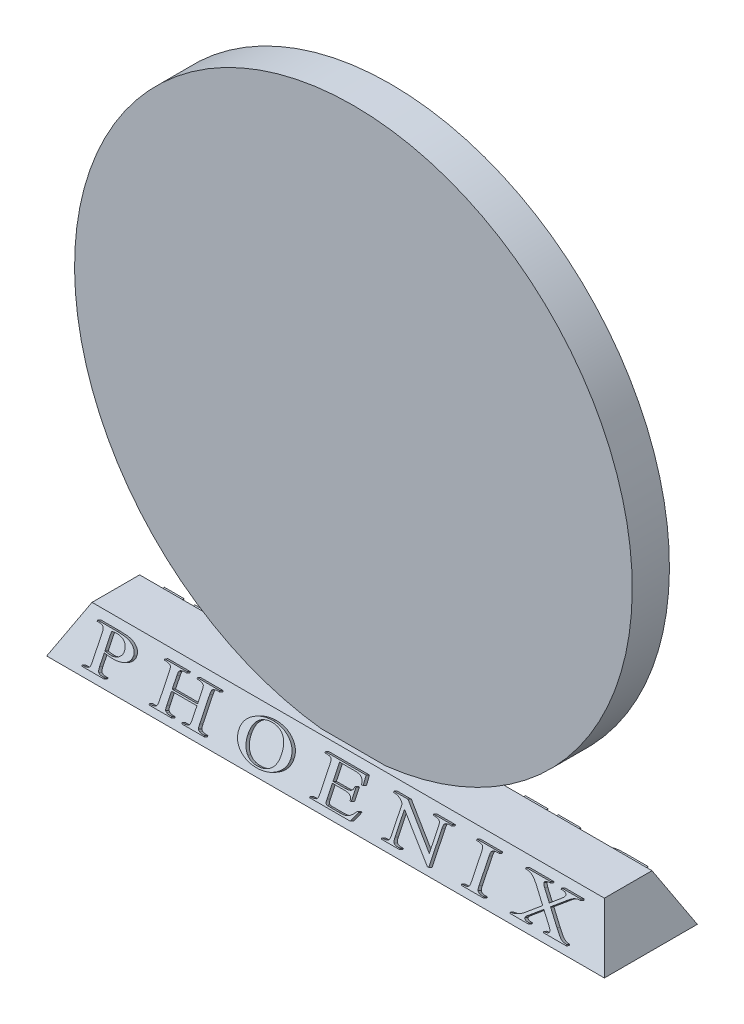
from build123d import *

# Parameters (mm, degrees)
SKETCH1_W                = 76.2
SKETCH1_H                = 12.7
BOSS_EXTRUDE1_DEPTH      = 6.35
BOSS_EXTRUDE1_TAPER      = 26
BOSS_EXTRUDE2_DEPTH      = 2.54
BOSS_EXTRUDE2_DEPTH_BACK = 2.54
SKETCH2_R                = 38.1
BOSS_EXTRUDE3_DEPTH      = 0.508
BOSS_EXTRUDE4_DEPTH      = 0.508


with BuildPart() as part:
    # Sketch1 → Boss-Extrude1 (new body)
    with BuildSketch(Plane(origin=(0, 0, 0), x_dir=(1, 0, 0), z_dir=(0, 1, 0))):
        Rectangle(SKETCH1_W, SKETCH1_H)
    extrude(amount=BOSS_EXTRUDE1_DEPTH, taper=BOSS_EXTRUDE1_TAPER)

    # Sketch2 → Boss-Extrude2 (add, two sides: drawn at the far end of the back side and taken through both)
    with BuildSketch(Plane.XY.offset(-BOSS_EXTRUDE2_DEPTH_BACK)):
        with Locations((0, 44.196)):
            Circle(SKETCH2_R)
    extrude(amount=BOSS_EXTRUDE2_DEPTH + BOSS_EXTRUDE2_DEPTH_BACK)

    # Sketch5 → Boss-Extrude3 (add)
    # profile 1 of 7: a face of its own
    with BuildSketch(Plane(origin=(0, 2.501934143, 5.129725184), x_dir=(1, 0, 0), z_dir=(0, 0.43837114678907857, 0.8987940462991666))):
        with BuildLine():
            Line((-31.263066798, 0.614679983), (-31.263066798, -0.832334885))
            add(Edge.make_bspline(
                [(-31.263066798, -0.832334885), (-31.262876054, -0.869871478), (-31.262513927, -0.941134556), (-31.254030253, -1.042309656), (-31.245255715, -1.13281422), (-31.227375703, -1.211255582), (-31.208270004, -1.279479402), (-31.182451041, -1.335980359), (-31.153749084, -1.38326217), (-31.128427208, -1.406437568), (-31.116560524, -1.417298342)],
                knots=[0, 0, 0, 0, 1.454495758, 2.761354632, 3.935530412, 4.974211907, 5.876973869, 6.675168202, 7.379139144, 8, 8, 8, 8], degree=3))
            add(Edge.make_bspline(
                [(-31.116560524, -1.417298342), (-31.099171674, -1.430496507), (-31.063717711, -1.457406125), (-31.003734575, -1.489784124), (-30.937927651, -1.517614893), (-30.86600413, -1.541223948), (-30.78681919, -1.557454585), (-30.702108998, -1.569964548), (-30.611066095, -1.579248309), (-30.548254744, -1.579564956), (-30.515672471, -1.579729211)],
                knots=[0, 0, 0, 0, 0.825061687, 1.682210642, 2.570187303, 3.527268453, 4.541124765, 5.624415337, 6.767707677, 8, 8, 8, 8], degree=3))
            Line((-30.515672471, -1.579729211), (-30.243892716, -1.579729211))
            Line((-30.243892716, -1.579729211), (-30.243892716, -1.715619088))
            Line((-30.243892716, -1.715619088), (-33.30141496, -1.715619088))
            Line((-33.30141496, -1.715619088), (-33.30141496, -1.579729211))
            Line((-33.30141496, -1.579729211), (-33.033881764, -1.579729211))
            add(Edge.make_bspline(
                [(-33.033881764, -1.579729211), (-32.997406658, -1.579177493), (-32.927153155, -1.578114848), (-32.82605894, -1.568380105), (-32.732773279, -1.553149812), (-32.647830468, -1.529174542), (-32.570094359, -1.501484088), (-32.500798832, -1.465898641), (-32.439911318, -1.42344568), (-32.404662796, -1.39013737), (-32.387343206, -1.373771115)],
                knots=[0, 0, 0, 0, 1.255739106, 2.418637797, 3.494503987, 4.505614182, 5.454125884, 6.331636621, 7.180238816, 8, 8, 8, 8], degree=3))
            add(Edge.make_bspline(
                [(-32.387343206, -1.373771115), (-32.378817762, -1.362695122), (-32.360617421, -1.339049804), (-32.339587181, -1.295038601), (-32.321846085, -1.241520777), (-32.307560482, -1.178153366), (-32.296036407, -1.105461469), (-32.287378685, -1.023265037), (-32.283957796, -0.931094242), (-32.282831492, -0.866307709), (-32.282240879, -0.832334885)],
                knots=[0, 0, 0, 0, 0.597134228, 1.274777664, 2.074999679, 3.008574951, 4.052343836, 5.225371831, 6.54503784, 8, 8, 8, 8], degree=3))
            Line((-32.282240879, -0.832334885), (-32.282240879, 2.293132298))
            add(Edge.make_bspline(
                [(-32.282240879, 2.293132298), (-32.282646544, 2.330647501), (-32.283416435, 2.401845816), (-32.289169074, 2.503311912), (-32.301338523, 2.593188849), (-32.314994468, 2.672386814), (-32.335420196, 2.739927818), (-32.359378606, 2.79708299), (-32.388459453, 2.843667322), (-32.41306519, 2.867172042), (-32.424500595, 2.878095755)],
                knots=[0, 0, 0, 0, 1.458120976, 2.767298279, 3.946086708, 4.981892924, 5.88690495, 6.681514112, 7.387239647, 8, 8, 8, 8], degree=3))
            add(Edge.make_bspline(
                [(-32.424500595, 2.878095755), (-32.44225225, 2.8912856), (-32.478454684, 2.918184753), (-32.539712298, 2.950860266), (-32.607154924, 2.97814242), (-32.680359507, 3.002077269), (-32.760287747, 3.018110539), (-32.84600934, 3.030940957), (-32.937792227, 3.039945187), (-33.001302606, 3.040329488), (-33.033881764, 3.040526624)],
                knots=[0, 0, 0, 0, 0.825660259, 1.683837962, 2.585261797, 3.543136988, 4.557426111, 5.627362168, 6.782899045, 8, 8, 8, 8], degree=3))
            Line((-33.033881764, 3.040526624), (-33.30141496, 3.040526624))
            Line((-33.30141496, 3.040526624), (-33.30141496, 3.176416502))
            Line((-33.30141496, 3.176416502), (-30.653685628, 3.176416502))
            add(Edge.make_bspline(
                [(-30.653685628, 3.176416502), (-30.575120803, 3.176018615), (-30.422210589, 3.175244211), (-30.199200436, 3.168977343), (-29.988655456, 3.157892967), (-29.790963763, 3.145366619), (-29.606340281, 3.125211032), (-29.434346641, 3.10417832), (-29.275197154, 3.075925975), (-29.082227369, 3.036329754), (-28.858693318, 2.972063402), (-28.610268429, 2.871613191), (-28.38375211, 2.747571072), (-28.213685496, 2.625196028), (-28.092160608, 2.5180787), (-28.013926406, 2.433143118), (-27.946654257, 2.345470078), (-27.891949149, 2.253608778), (-27.850045308, 2.157971887), (-27.820283577, 2.058520606), (-27.801693362, 1.955158838), (-27.799154982, 1.884831664), (-27.797874921, 1.849366917)],
                knots=[0, 0, 0, 0, 1.362675381, 2.652166327, 3.869025128, 5.019587935, 6.087181716, 7.0898457, 8.024263393, 8.889798343, 10.506044358, 12.050486658, 13.528402421, 14.974728095, 15.674586513, 16.334806232, 16.974388965, 17.58808972, 18.184511933, 18.780649827, 19.385103334, 20, 20, 20, 20], degree=3))
            add(Edge.make_bspline(
                [(-27.797874921, 1.849366917), (-27.799730409, 1.801456401), (-27.803390567, 1.706947544), (-27.831865693, 1.569002582), (-27.877633975, 1.438127994), (-27.942631373, 1.314256616), (-28.025933164, 1.197267011), (-28.1278576, 1.087356315), (-28.248262079, 0.984955886), (-28.385950562, 0.890155384), (-28.540222176, 0.803700067), (-28.710777817, 0.7304872), (-28.895223809, 0.665751227), (-29.095923947, 0.616002941), (-29.311053005, 0.575533331), (-29.541579924, 0.547739877), (-29.786715365, 0.528776688), (-29.95544176, 0.527315211), (-30.04218118, 0.526563891)],
                knots=[0, 0, 0, 0, 0.794328886, 1.566902649, 2.326337517, 3.087857253, 3.879534819, 4.702171405, 5.568201676, 6.496470214, 7.471567602, 8.496873715, 9.571887238, 10.711020628, 11.923511334, 13.20149137, 14.561333494, 16, 16, 16, 16], degree=3))
            add(Edge.make_bspline(
                [(-30.04218118, 0.526563891), (-30.133153226, 0.527586505), (-30.32267503, 0.529716915), (-30.617205059, 0.548170181), (-30.933352979, 0.575509649), (-31.150597273, 0.60131849), (-31.263066798, 0.614679983)],
                knots=[0, 0, 0, 0, 0.891233505, 1.856704217, 2.890394524, 4, 4, 4, 4], degree=3))
        make_face()
        with BuildLine():
            add(Edge.make_bspline(
                [(-31.263066798, 0.804713484), (-31.217056189, 0.7991065), (-31.127867053, 0.788237659), (-30.998512896, 0.771560315), (-30.877033196, 0.759296356), (-30.763513979, 0.747954198), (-30.65757451, 0.741427897), (-30.559637882, 0.734126546), (-30.469687393, 0.731183243), (-30.412340547, 0.730651417), (-30.385090792, 0.730398707)],
                knots=[0, 0, 0, 0, 1.26171378, 2.445765541, 3.549972576, 4.585174375, 5.550812159, 6.438913018, 7.258211367, 8, 8, 8, 8], degree=3))
            add(Edge.make_bspline(
                [(-30.385090792, 0.730398707), (-30.339388718, 0.730973481), (-30.249498096, 0.732103995), (-30.117292264, 0.748224912), (-29.989657607, 0.770666939), (-29.867135761, 0.804409266), (-29.748586998, 0.844913072), (-29.63600048, 0.89804302), (-29.527200898, 0.95813827), (-29.424899847, 1.027871338), (-29.330981875, 1.104791724), (-29.246969525, 1.187183541), (-29.177972002, 1.27760835), (-29.119857626, 1.371767516), (-29.075999998, 1.472376044), (-29.043896815, 1.578090325), (-29.024472074, 1.689763845), (-29.022089599, 1.766129214), (-29.020883819, 1.804778051)],
                knots=[0, 0, 0, 0, 1.13457109, 2.231568287, 3.304058039, 4.351098098, 5.385365276, 6.411945138, 7.439127055, 8.470513521, 9.482422057, 10.452134393, 11.38583388, 12.300974551, 13.194451764, 14.103831982, 15.040341333, 16, 16, 16, 16], degree=3))
            add(Edge.make_bspline(
                [(-29.020883819, 1.804778051), (-29.023022632, 1.858418301), (-29.027279159, 1.965169664), (-29.064964986, 2.12182896), (-29.126408139, 2.272360452), (-29.211396705, 2.414943406), (-29.31733519, 2.54706822), (-29.444835425, 2.663022197), (-29.593897352, 2.759016861), (-29.761112764, 2.836740221), (-29.943521029, 2.898002713), (-30.139310224, 2.940940554), (-30.346803994, 2.968307142), (-30.489396273, 2.971134469), (-30.562384617, 2.972581686)],
                knots=[0, 0, 0, 0, 0.89080169, 1.772816021, 2.662198106, 3.585498239, 4.522771788, 5.468300984, 6.437675731, 7.458893366, 8.526888582, 9.630308864, 10.78703228, 12, 12, 12, 12], degree=3))
            add(Edge.make_bspline(
                [(-30.562384617, 2.972581686), (-30.611249758, 2.971750539), (-30.715169239, 2.969982975), (-30.8808285, 2.954465689), (-31.065688287, 2.932652487), (-31.195185521, 2.912182178), (-31.263066798, 2.901451828)],
                knots=[0, 0, 0, 0, 0.831630095, 1.768593411, 2.830316882, 4, 4, 4, 4], degree=3))
            Line((-31.263066798, 2.901451828), (-31.263066798, 0.804713484))
        make_face(mode=Mode.SUBTRACT)
    # profile 2 of 7: a face of its own
    with BuildSketch(Plane(origin=(0, 2.501934143, 5.129725184), x_dir=(1, 0, 0), z_dir=(0, 0.43837114678907857, 0.8987940462991666))):
        with BuildLine():
            Line((-22.090500066, 0.866288584), (-18.62530819, 0.866288584))
            Line((-18.62530819, 0.866288584), (-18.62530819, 2.293132298))
            add(Edge.make_bspline(
                [(-18.62530819, 2.293132298), (-18.625489244, 2.323569165), (-18.62583462, 2.381630104), (-18.629035011, 2.464829659), (-18.634146725, 2.539912846), (-18.641395504, 2.60688217), (-18.650840008, 2.665755679), (-18.662294715, 2.71651002), (-18.675368922, 2.759556937), (-18.687646966, 2.784087288), (-18.693253128, 2.795287861)],
                knots=[0, 0, 0, 0, 1.430439766, 2.728686847, 3.912476005, 4.966733584, 5.893654093, 6.712679995, 7.412208929, 8, 8, 8, 8], degree=3))
            add(Edge.make_bspline(
                [(-18.693253128, 2.795287861), (-18.703918857, 2.810747254), (-18.726481828, 2.843451051), (-18.77731547, 2.883428523), (-18.839702217, 2.921898919), (-18.888225507, 2.941805935), (-18.914074179, 2.952410532)],
                knots=[0, 0, 0, 0, 0.813562486, 1.721062584, 2.785995255, 4, 4, 4, 4], degree=3))
            add(Edge.make_bspline(
                [(-18.914074179, 2.952410532), (-18.95206548, 2.965914148), (-19.028102274, 2.992940642), (-19.146675258, 3.019803375), (-19.268103001, 3.037864012), (-19.350340844, 3.039634032), (-19.39181203, 3.040526624)],
                knots=[0, 0, 0, 0, 0.989778699, 1.98096927, 2.981836146, 4, 4, 4, 4], degree=3))
            Line((-19.39181203, 3.040526624), (-19.644482271, 3.040526624))
            Line((-19.644482271, 3.040526624), (-19.644482271, 3.176416502))
            Line((-19.644482271, 3.176416502), (-16.586960027, 3.176416502))
            Line((-16.586960027, 3.176416502), (-16.586960027, 3.040526624))
            Line((-16.586960027, 3.040526624), (-16.839630268, 3.040526624))
            add(Edge.make_bspline(
                [(-16.839630268, 3.040526624), (-16.881097154, 3.03956994), (-16.963278764, 3.037673923), (-17.084568599, 3.020587759), (-17.203438195, 2.996441299), (-17.279395405, 2.969917122), (-17.317368119, 2.956657091)],
                knots=[0, 0, 0, 0, 1.02012933, 2.021754696, 3.011030784, 4, 4, 4, 4], degree=3))
            add(Edge.make_bspline(
                [(-17.317368119, 2.956657091), (-17.343663976, 2.946649566), (-17.393686647, 2.927612228), (-17.458095155, 2.885404564), (-17.509967537, 2.836708099), (-17.542795825, 2.788294737), (-17.560594504, 2.742378234), (-17.573428841, 2.70096537), (-17.583707505, 2.651900588), (-17.592124158, 2.595185415), (-17.598317464, 2.530687043), (-17.602098763, 2.458422567), (-17.605703493, 2.378451284), (-17.605985839, 2.322509368), (-17.606134108, 2.293132298)],
                knots=[0, 0, 0, 0, 1.280992633, 2.436835235, 3.487820764, 4.513683505, 5.071564454, 5.730629727, 6.490966837, 7.356710103, 8.346725405, 9.446947342, 10.659302127, 12, 12, 12, 12], degree=3))
            Line((-17.606134108, 2.293132298), (-17.606134108, -0.832334885))
            add(Edge.make_bspline(
                [(-17.606134108, -0.832334885), (-17.605951727, -0.862418165), (-17.605601872, -0.920125778), (-17.602379735, -1.002966932), (-17.597408168, -1.077714661), (-17.589814681, -1.144634798), (-17.580880156, -1.203241125), (-17.569018714, -1.25392531), (-17.555851013, -1.296882585), (-17.543777849, -1.321864606), (-17.53818917, -1.333428808)],
                knots=[0, 0, 0, 0, 1.416969577, 2.718118889, 3.904554408, 4.944603284, 5.890050044, 6.694667606, 7.395760336, 8, 8, 8, 8], degree=3))
            add(Edge.make_bspline(
                [(-17.53818917, -1.333428808), (-17.527931336, -1.348932817), (-17.506099742, -1.381929769), (-17.455464544, -1.420952489), (-17.39489486, -1.46006311), (-17.347829549, -1.480624463), (-17.322676317, -1.491613118)],
                knots=[0, 0, 0, 0, 0.815951758, 1.736578061, 2.790353744, 4, 4, 4, 4], degree=3))
            add(Edge.make_bspline(
                [(-17.322676317, -1.491613118), (-17.283973891, -1.505121061), (-17.206498321, -1.532161628), (-17.086148798, -1.55888845), (-16.963688626, -1.577031346), (-16.881100988, -1.578827358), (-16.839630268, -1.579729211)],
                knots=[0, 0, 0, 0, 0.995818953, 1.993457501, 2.992430782, 4, 4, 4, 4], degree=3))
            Line((-16.839630268, -1.579729211), (-16.586960027, -1.579729211))
            Line((-16.586960027, -1.579729211), (-16.586960027, -1.715619088))
            Line((-16.586960027, -1.715619088), (-19.644482271, -1.715619088))
            Line((-19.644482271, -1.715619088), (-19.644482271, -1.579729211))
            Line((-19.644482271, -1.579729211), (-19.39181203, -1.579729211))
            add(Edge.make_bspline(
                [(-19.39181203, -1.579729211), (-19.356756693, -1.579093024), (-19.289016753, -1.577863675), (-19.191187418, -1.569174749), (-19.100144306, -1.556025198), (-19.017043336, -1.535372829), (-18.940063162, -1.512128241), (-18.87246319, -1.478888297), (-18.809590278, -1.444314227), (-18.774210286, -1.414025611), (-18.756951508, -1.399250467)],
                knots=[0, 0, 0, 0, 1.247402742, 2.410445782, 3.493404529, 4.516720968, 5.456660224, 6.346851647, 7.193574747, 8, 8, 8, 8], degree=3))
            add(Edge.make_bspline(
                [(-18.756951508, -1.399250467), (-18.746195773, -1.387947554), (-18.723473472, -1.364069299), (-18.697548732, -1.317586174), (-18.673749904, -1.262365737), (-18.656950014, -1.195567955), (-18.641521274, -1.119531422), (-18.633127681, -1.032763986), (-18.626229373, -0.936133849), (-18.625625536, -0.868093482), (-18.62530819, -0.832334885)],
                knots=[0, 0, 0, 0, 0.626897779, 1.324368774, 2.130075953, 3.047459146, 4.094127793, 5.257095117, 6.558467025, 8, 8, 8, 8], degree=3))
            Line((-18.62530819, -0.832334885), (-18.62530819, 0.662453768))
            Line((-18.62530819, 0.662453768), (-22.090500066, 0.662453768))
            Line((-22.090500066, 0.662453768), (-22.090500066, -0.832334885))
            add(Edge.make_bspline(
                [(-22.090500066, -0.832334885), (-22.090317685, -0.862418165), (-22.08996783, -0.920125778), (-22.086745693, -1.002966932), (-22.081774126, -1.077714661), (-22.074180639, -1.144634798), (-22.065246114, -1.203241125), (-22.053384671, -1.25392531), (-22.040216971, -1.296882585), (-22.028143807, -1.321864606), (-22.022555127, -1.333428808)],
                knots=[0, 0, 0, 0, 1.416969577, 2.718118889, 3.904554408, 4.944603284, 5.890050044, 6.694667606, 7.395760336, 8, 8, 8, 8], degree=3))
            add(Edge.make_bspline(
                [(-22.022555127, -1.333428808), (-22.01228741, -1.348917665), (-21.990434779, -1.381882371), (-21.939501352, -1.421558205), (-21.87697126, -1.459923708), (-21.828617013, -1.480581697), (-21.802795716, -1.491613118)],
                knots=[0, 0, 0, 0, 0.804902655, 1.713062419, 2.778769196, 4, 4, 4, 4], degree=3))
            add(Edge.make_bspline(
                [(-21.802795716, -1.491613118), (-21.765165475, -1.505139195), (-21.689534794, -1.532324416), (-21.571584216, -1.558860194), (-21.450550021, -1.577143875), (-21.368655864, -1.578860061), (-21.327181145, -1.579729211)],
                knots=[0, 0, 0, 0, 0.985687466, 1.981071965, 2.977528088, 4, 4, 4, 4], degree=3))
            Line((-21.327181145, -1.579729211), (-21.071325985, -1.579729211))
            Line((-21.071325985, -1.579729211), (-21.071325985, -1.715619088))
            Line((-21.071325985, -1.715619088), (-24.128848229, -1.715619088))
            Line((-24.128848229, -1.715619088), (-24.128848229, -1.579729211))
            Line((-24.128848229, -1.579729211), (-23.876177988, -1.579729211))
            add(Edge.make_bspline(
                [(-23.876177988, -1.579729211), (-23.840768467, -1.579095306), (-23.772321342, -1.577869959), (-23.673439836, -1.569142299), (-23.581657457, -1.556165792), (-23.497904644, -1.535221998), (-23.42027053, -1.512038186), (-23.351876749, -1.479518289), (-23.289449168, -1.443661869), (-23.253681239, -1.413936816), (-23.236009268, -1.399250467)],
                knots=[0, 0, 0, 0, 1.250607447, 2.41744265, 3.504694442, 4.520389702, 5.46522863, 6.3601247, 7.189781777, 8, 8, 8, 8], degree=3))
            add(Edge.make_bspline(
                [(-23.236009268, -1.399250467), (-23.225607637, -1.387933908), (-23.203579734, -1.363968427), (-23.178764834, -1.317499503), (-23.156064428, -1.262275329), (-23.140165245, -1.195536199), (-23.126608471, -1.119326068), (-23.115567302, -1.032915042), (-23.111162348, -0.936067573), (-23.110186936, -0.868078004), (-23.109674147, -0.832334885)],
                knots=[0, 0, 0, 0, 0.619698749, 1.312358032, 2.11537007, 3.032231406, 4.079867258, 5.248509142, 6.553500676, 8, 8, 8, 8], degree=3))
            Line((-23.109674147, -0.832334885), (-23.109674147, 2.293132298))
            add(Edge.make_bspline(
                [(-23.109674147, 2.293132298), (-23.109855201, 2.323569165), (-23.110200578, 2.381630104), (-23.113400968, 2.464829659), (-23.118512683, 2.539912846), (-23.125761462, 2.60688217), (-23.135205966, 2.665755679), (-23.146660673, 2.71651002), (-23.15973488, 2.759556937), (-23.172012924, 2.784087288), (-23.177619086, 2.795287861)],
                knots=[0, 0, 0, 0, 1.430439766, 2.728686847, 3.912476005, 4.966733584, 5.893654093, 6.712679995, 7.412208929, 8, 8, 8, 8], degree=3))
            add(Edge.make_bspline(
                [(-23.177619086, 2.795287861), (-23.187875544, 2.810794819), (-23.209704211, 2.843798047), (-23.260364739, 2.882766468), (-23.320691358, 2.922048868), (-23.367943187, 2.941853294), (-23.393131939, 2.952410532)],
                knots=[0, 0, 0, 0, 0.817296659, 1.739440394, 2.794952974, 4, 4, 4, 4], degree=3))
            add(Edge.make_bspline(
                [(-23.393131939, 2.952410532), (-23.431834365, 2.965918474), (-23.509309935, 2.992959042), (-23.629659458, 3.019685863), (-23.75211963, 3.037828759), (-23.834707268, 3.039624771), (-23.876177988, 3.040526624)],
                knots=[0, 0, 0, 0, 0.995818953, 1.993457501, 2.992430782, 4, 4, 4, 4], degree=3))
            Line((-23.876177988, 3.040526624), (-24.128848229, 3.040526624))
            Line((-24.128848229, 3.040526624), (-24.128848229, 3.176416502))
            Line((-24.128848229, 3.176416502), (-21.071325985, 3.176416502))
            Line((-21.071325985, 3.176416502), (-21.071325985, 3.040526624))
            Line((-21.071325985, 3.040526624), (-21.327181145, 3.040526624))
            add(Edge.make_bspline(
                [(-21.327181145, 3.040526624), (-21.368651207, 3.039592026), (-21.450488042, 3.037747693), (-21.571388716, 3.020451455), (-21.689629058, 2.99661438), (-21.765183315, 2.969937412), (-21.802795716, 2.956657091)],
                knots=[0, 0, 0, 0, 1.024462587, 2.021669915, 3.015148203, 4, 4, 4, 4], degree=3))
            add(Edge.make_bspline(
                [(-21.802795716, 2.956657091), (-21.828455416, 2.946710296), (-21.87726431, 2.927789888), (-21.939477301, 2.884352266), (-21.992492592, 2.83725808), (-22.024458883, 2.787881408), (-22.044223883, 2.742668043), (-22.056596845, 2.700911129), (-22.067123505, 2.65192545), (-22.075091651, 2.595107593), (-22.083121608, 2.530772744), (-22.086328721, 2.458407657), (-22.090109196, 2.378455641), (-22.090365482, 2.322510869), (-22.090500066, 2.293132298)],
                knots=[0, 0, 0, 0, 1.255182666, 2.38756014, 3.453549157, 4.482576428, 5.048475332, 5.709573657, 6.472256216, 7.340670085, 8.335455966, 9.439071812, 10.655166409, 12, 12, 12, 12], degree=3))
            Line((-22.090500066, 2.293132298), (-22.090500066, 0.866288584))
        make_face()
    # profile 3 of 7: a face of its own
    with BuildSketch(Plane(origin=(0, 2.501934143, 5.129725184), x_dir=(1, 0, 0), z_dir=(0, 0.43837114678907857, 0.8987940462991666))):
        with BuildLine():
            add(Edge.make_bspline(
                [(-9.315789941, 3.244361441), (-9.200685338, 3.242593272), (-8.973848855, 3.239108743), (-8.639449283, 3.203388285), (-8.316422486, 3.149198232), (-8.004880318, 3.071766744), (-7.706028388, 2.970181737), (-7.418141421, 2.848188565), (-7.142428982, 2.703069919), (-6.923385437, 2.565039353), (-6.757946674, 2.444460471), (-6.640268386, 2.352245043), (-6.531848568, 2.256118521), (-6.430781567, 2.157352493), (-6.337699472, 2.056460017), (-6.25369548, 1.951637537), (-6.176884892, 1.845171907), (-6.107168611, 1.736286433), (-6.048676449, 1.622744715), (-5.994246146, 1.508544338), (-5.951303466, 1.389819086), (-5.915210284, 1.268933726), (-5.886107052, 1.145314996), (-5.866156348, 1.018991397), (-5.854308363, 0.889872189), (-5.852548718, 0.80296869), (-5.851659704, 0.759062978)],
                knots=[0, 0, 0, 0, 1.756539919, 3.461610832, 5.127726306, 6.753711168, 8.35612972, 9.941511251, 11.521840965, 13.107480186, 13.888726046, 14.646361548, 15.388842226, 16.099388275, 16.802917432, 17.482927431, 18.148602474, 18.80656069, 19.454191917, 20.097119615, 20.736360014, 21.379015305, 22.022419439, 22.673421545, 23.329781048, 24, 24, 24, 24], degree=3))
            add(Edge.make_bspline(
                [(-5.851659704, 0.759062978), (-5.852554973, 0.713743464), (-5.854327479, 0.624017255), (-5.866060312, 0.490996749), (-5.886176687, 0.361170685), (-5.914992756, 0.234198661), (-5.952254887, 0.110190893), (-5.996944761, -0.011051332), (-6.048851139, -0.1294251), (-6.109962513, -0.244449048), (-6.178706853, -0.357135814), (-6.256997684, -0.466311468), (-6.341257155, -0.57395807), (-6.435744723, -0.677063361), (-6.537433658, -0.777677237), (-6.647016741, -0.875811453), (-6.765362551, -0.969845399), (-6.93217994, -1.093434989), (-7.154108798, -1.234016307), (-7.434855089, -1.381644325), (-7.729539721, -1.505462718), (-8.037432472, -1.608079383), (-8.359281266, -1.68626044), (-8.694231493, -1.742045448), (-9.042917723, -1.77697155), (-9.27996496, -1.781339112), (-9.400721114, -1.783564027)],
                knots=[0, 0, 0, 0, 0.674228387, 1.334876553, 1.984929638, 2.627369468, 3.270326839, 3.909956049, 4.548761357, 5.191697172, 5.846339224, 6.511003016, 7.189350525, 7.878883681, 8.589948892, 9.317049678, 10.066101423, 10.837952703, 12.405080528, 13.968773217, 15.55188856, 17.155176889, 18.792194798, 20.47392981, 22.203755998, 24, 24, 24, 24], degree=3))
            add(Edge.make_bspline(
                [(-9.400721114, -1.783564027), (-9.522553011, -1.78186343), (-9.761404796, -1.778529405), (-10.111919483, -1.742362206), (-10.448349237, -1.690199634), (-10.769534566, -1.611630747), (-11.076685628, -1.514143791), (-11.367199706, -1.390297369), (-11.644930135, -1.2487344), (-11.862608127, -1.110394961), (-12.02643058, -0.990360569), (-12.142034074, -0.897723578), (-12.249124057, -0.801346805), (-12.348046958, -0.701098023), (-12.439695204, -0.59841214), (-12.522533425, -0.491679394), (-12.598322662, -0.382539866), (-12.665202629, -0.269458737), (-12.724789242, -0.153547895), (-12.777100103, -0.03461308), (-12.820716058, 0.087792193), (-12.855758931, 0.21381928), (-12.883053487, 0.342929917), (-12.903695896, 0.475411015), (-12.915197047, 0.610935806), (-12.917017507, 0.702422138), (-12.917933334, 0.748446581)],
                knots=[0, 0, 0, 0, 1.818540433, 3.565253748, 5.256675508, 6.898470768, 8.497705591, 10.063066761, 11.608699583, 13.147960128, 13.907878358, 14.640710673, 15.359092899, 16.057830178, 16.742845608, 17.41300503, 18.074061054, 18.7256509, 19.373199973, 20.019194823, 20.664346238, 21.311809064, 21.970961546, 22.633852463, 23.312725969, 24, 24, 24, 24], degree=3))
            add(Edge.make_bspline(
                [(-12.917933334, 0.748446581), (-12.917202404, 0.795545106), (-12.915753791, 0.888888483), (-12.901587518, 1.027284667), (-12.877973516, 1.162298929), (-12.84649677, 1.294480252), (-12.8045417, 1.422997899), (-12.755139294, 1.548636683), (-12.694804303, 1.670364555), (-12.626146106, 1.788919778), (-12.547832727, 1.904349079), (-12.461125496, 2.016534072), (-12.364960214, 2.125337796), (-12.259598498, 2.230572302), (-12.144735416, 2.332207038), (-12.021233225, 2.431247962), (-11.888437629, 2.527079856), (-11.794680364, 2.586618755), (-11.74694478, 2.616932397)],
                knots=[0, 0, 0, 0, 0.97739072, 1.937065949, 2.883835491, 3.820953073, 4.754783019, 5.687774789, 6.620737642, 7.571941993, 8.529478353, 9.513882448, 10.513083898, 11.541503719, 12.602919383, 13.695027174, 14.826445884, 16, 16, 16, 16], degree=3))
            add(Edge.make_bspline(
                [(-11.74694478, 2.616932397), (-11.661032996, 2.667588317), (-11.488614352, 2.76925103), (-11.214184609, 2.895857201), (-10.928004905, 3.003111078), (-10.629621841, 3.09131026), (-10.318964018, 3.160610944), (-9.995367894, 3.208530498), (-9.659654976, 3.239392564), (-9.431577999, 3.242688294), (-9.315789941, 3.244361441)],
                knots=[0, 0, 0, 0, 0.940645269, 1.887805994, 2.847324729, 3.82256105, 4.821521246, 5.848243037, 6.907615477, 8, 8, 8, 8], degree=3))
        make_face()
        with BuildLine():
            add(Edge.make_bspline(
                [(-9.416645709, 3.040526624), (-9.495269442, 3.039262543), (-9.64898891, 3.036791102), (-9.873246026, 3.012779342), (-10.085526243, 2.974859712), (-10.286137871, 2.922165505), (-10.474728062, 2.852823427), (-10.651965417, 2.768778979), (-10.817661055, 2.669525793), (-10.917880159, 2.590430656), (-10.967701264, 2.551110737)],
                knots=[0, 0, 0, 0, 1.136191322, 2.221399575, 3.255894657, 4.251027871, 5.215582743, 6.156002578, 7.083308627, 8, 8, 8, 8], degree=3))
            add(Edge.make_bspline(
                [(-10.967701264, 2.551110737), (-11.02610763, 2.498743667), (-11.142032001, 2.39480603), (-11.290349274, 2.213910113), (-11.415175384, 2.015538534), (-11.518904399, 1.799956518), (-11.598331169, 1.566018543), (-11.653954594, 1.314666633), (-11.688467054, 1.046308737), (-11.692733304, 0.861441639), (-11.694924437, 0.766494455)],
                knots=[0, 0, 0, 0, 0.943662233, 1.872971353, 2.805879718, 3.760907175, 4.747489756, 5.774202673, 6.856837205, 8, 8, 8, 8], degree=3))
            add(Edge.make_bspline(
                [(-11.694924437, 0.766494455), (-11.692787269, 0.669069986), (-11.688622628, 0.479221499), (-11.653223996, 0.202893428), (-11.594289466, -0.056183694), (-11.51091222, -0.297677148), (-11.40585282, -0.522789962), (-11.275436302, -0.729966446), (-11.12092582, -0.919783045), (-11.001293702, -1.030443146), (-10.941160272, -1.086066765)],
                knots=[0, 0, 0, 0, 1.131333001, 2.204598702, 3.229668465, 4.212449379, 5.166802318, 6.108850167, 7.049408073, 8, 8, 8, 8], degree=3))
            add(Edge.make_bspline(
                [(-10.941160272, -1.086066765), (-10.891730303, -1.125781196), (-10.792716352, -1.205333799), (-10.628405507, -1.304635197), (-10.453877301, -1.389710861), (-10.26788283, -1.460458994), (-10.070102165, -1.514171489), (-9.860512558, -1.551939995), (-9.639797586, -1.575972391), (-9.488547192, -1.578459567), (-9.411337511, -1.579729211)],
                knots=[0, 0, 0, 0, 0.925980556, 1.854846243, 2.798728367, 3.761360857, 4.759005068, 5.78982453, 6.871758685, 8, 8, 8, 8], degree=3))
            add(Edge.make_bspline(
                [(-9.411337511, -1.579729211), (-9.328463224, -1.578168922), (-9.166200755, -1.575113979), (-8.928352103, -1.549091474), (-8.70197652, -1.506673286), (-8.485888022, -1.44889764), (-8.281757334, -1.37150373), (-8.087132205, -1.279869458), (-7.905417961, -1.167977407), (-7.733703031, -1.04270827), (-7.577242787, -0.89816136), (-7.441793315, -0.732261349), (-7.327107747, -0.546717053), (-7.235084535, -0.341110003), (-7.16300906, -0.116747239), (-7.111251672, 0.126836162), (-7.080579857, 0.389889401), (-7.076680731, 0.571776503), (-7.074668601, 0.665638687)],
                knots=[0, 0, 0, 0, 1.078480985, 2.111595715, 3.109867126, 4.074192863, 5.018722629, 5.947909, 6.869805544, 7.791989726, 8.711062656, 9.634074735, 10.571049133, 11.541996739, 12.558747355, 13.632940912, 14.778487692, 16, 16, 16, 16], degree=3))
            add(Edge.make_bspline(
                [(-7.074668601, 0.665638687), (-7.076816291, 0.767660463), (-7.080975254, 0.965223872), (-7.115658399, 1.251538401), (-7.17084943, 1.518148832), (-7.250339993, 1.765130784), (-7.353831062, 1.991511622), (-7.478996237, 2.198470616), (-7.62610893, 2.386976623), (-7.743297493, 2.493568327), (-7.801891774, 2.546864179)],
                knots=[0, 0, 0, 0, 1.174962106, 2.27529385, 3.317134605, 4.307257947, 5.257702061, 6.177803628, 7.088901814, 8, 8, 8, 8], degree=3))
            add(Edge.make_bspline(
                [(-7.801891774, 2.546864179), (-7.851965187, 2.586701157), (-7.953011993, 2.667091112), (-8.12254182, 2.765520312), (-8.304146609, 2.851478296), (-8.499819617, 2.921057892), (-8.709385679, 2.975523462), (-8.932887973, 3.012678348), (-9.170166007, 3.036877313), (-9.333067345, 3.039289186), (-9.416645709, 3.040526624)],
                knots=[0, 0, 0, 0, 0.889889851, 1.795773868, 2.721540662, 3.684735467, 4.682656539, 5.732496357, 6.836631751, 8, 8, 8, 8], degree=3))
        make_face(mode=Mode.SUBTRACT)
    # profile 4 of 7: a face of its own
    with BuildSketch(Plane(origin=(0, 2.501934143, 5.129725184), x_dir=(1, 0, 0), z_dir=(0, 0.43837114678907857, 0.8987940462991666))):
        with BuildLine():
            Line((-0.144284849, 2.972581686), (-0.144284849, 0.934233523))
            Line((-0.144284849, 0.934233523), (1.418448743, 0.934233523))
            add(Edge.make_bspline(
                [(1.418448743, 0.934233523), (1.468703294, 0.934712547), (1.564994984, 0.935630394), (1.702754939, 0.940549812), (1.827795969, 0.949965692), (1.939391517, 0.963437618), (2.038262856, 0.980505754), (2.123991876, 0.999932508), (2.197451229, 1.023496947), (2.2396722, 1.045191701), (2.25926736, 1.055260445)],
                knots=[0, 0, 0, 0, 1.408200946, 2.698224245, 3.861814795, 4.920777975, 5.846736337, 6.671726961, 7.383535653, 8, 8, 8, 8], degree=3))
            add(Edge.make_bspline(
                [(2.25926736, 1.055260445), (2.282029654, 1.069111782), (2.326898177, 1.096415226), (2.385732281, 1.148615241), (2.437151889, 1.207445944), (2.481081608, 1.273678657), (2.516296427, 1.348170118), (2.54326547, 1.429914982), (2.564300973, 1.519023511), (2.570367606, 1.58136402), (2.573512702, 1.613682911)],
                knots=[0, 0, 0, 0, 0.954400136, 1.881292125, 2.808184113, 3.751967677, 4.723112952, 5.755024992, 6.836148402, 8, 8, 8, 8], degree=3))
            Line((2.573512702, 1.613682911), (2.709402579, 1.613682911))
            Line((2.709402579, 1.613682911), (2.709402579, 0.050949319))
            Line((2.709402579, 0.050949319), (2.573512702, 0.050949319))
            add(Edge.make_bspline(
                [(2.573512702, 0.050949319), (2.561452419, 0.101763501), (2.539536697, 0.194102096), (2.500964778, 0.315643206), (2.466995171, 0.410067447), (2.435178872, 0.457592139), (2.421698229, 0.477728466)],
                knots=[0, 0, 0, 0, 1.374684194, 2.498050764, 3.363620485, 4, 4, 4, 4], degree=3))
            add(Edge.make_bspline(
                [(2.421698229, 0.477728466), (2.403665197, 0.497319502), (2.365880313, 0.538368895), (2.290695457, 0.586126097), (2.202433802, 0.630074771), (2.095263153, 0.666091928), (1.966440999, 0.696195187), (1.81000679, 0.716097235), (1.624255617, 0.728432794), (1.490310551, 0.729712267), (1.418448743, 0.730398707)],
                knots=[0, 0, 0, 0, 0.59877681, 1.2546261, 1.994170947, 2.822838321, 3.799450339, 4.976687658, 6.377986604, 8, 8, 8, 8], degree=3))
            Line((1.418448743, 0.730398707), (-0.144284849, 0.730398707))
            Line((-0.144284849, 0.730398707), (-0.144284849, -0.94274541))
            add(Edge.make_bspline(
                [(-0.144284849, -0.94274541), (-0.144015088, -0.96928744), (-0.143500661, -1.019902511), (-0.141467015, -1.091759754), (-0.138227967, -1.155462012), (-0.134582322, -1.210801163), (-0.127963161, -1.257865208), (-0.120884818, -1.296925201), (-0.112831786, -1.328015011), (-0.100033561, -1.358789942), (-0.076768798, -1.389229203), (-0.042018217, -1.420055211), (-0.000273675, -1.447649069), (0.05153695, -1.473009326), (0.121057915, -1.490112846), (0.211233054, -1.503547842), (0.325597455, -1.509670218), (0.409537409, -1.511035833), (0.455541564, -1.511784272)],
                knots=[0, 0, 0, 0, 1.250565387, 2.384800833, 3.386413899, 4.255956757, 4.996345821, 5.624179568, 6.125748733, 6.506675764, 7.186996423, 7.907018742, 8.688505401, 9.538650811, 10.61051372, 12.044174034, 13.831968927, 16, 16, 16, 16], degree=3))
            Line((0.455541564, -1.511784272), (1.687043579, -1.511784272))
            add(Edge.make_bspline(
                [(1.687043579, -1.511784272), (1.736589574, -1.511626597), (1.832153639, -1.511322475), (1.970162888, -1.50771969), (2.097952633, -1.503902794), (2.215128014, -1.497647503), (2.321692485, -1.489252703), (2.41767364, -1.478810535), (2.502956551, -1.4660669), (2.60331207, -1.448139036), (2.720319221, -1.415201124), (2.855955917, -1.361463264), (2.989393352, -1.293843928), (3.073375762, -1.237712731), (3.116010572, -1.209216967)],
                knots=[0, 0, 0, 0, 1.198458383, 2.311580482, 3.339374841, 4.290944019, 5.149698779, 5.924857735, 6.625801592, 7.235261285, 8.389968308, 9.558333512, 10.76045486, 12, 12, 12, 12], degree=3))
            add(Edge.make_bspline(
                [(3.116010572, -1.209216967), (3.172474933, -1.16568545), (3.29142248, -1.07398217), (3.459758382, -0.907403942), (3.631320415, -0.712543105), (3.739832608, -0.568080443), (3.796521599, -0.492610191)],
                knots=[0, 0, 0, 0, 0.86172438, 1.815304368, 2.858670282, 4, 4, 4, 4], degree=3))
            Line((3.796521599, -0.492610191), (4.000356415, -0.492610191))
            Line((4.000356415, -0.492610191), (3.375050651, -1.715619088))
            Line((3.375050651, -1.715619088), (-2.182633011, -1.715619088))
            Line((-2.182633011, -1.715619088), (-2.182633011, -1.579729211))
            Line((-2.182633011, -1.579729211), (-1.92996277, -1.579729211))
            add(Edge.make_bspline(
                [(-1.92996277, -1.579729211), (-1.888502798, -1.57874121), (-1.80633489, -1.576783131), (-1.684868436, -1.560143727), (-1.566303203, -1.53426242), (-1.490223038, -1.507943154), (-1.45222492, -1.494798037)],
                knots=[0, 0, 0, 0, 1.019650728, 2.020806173, 3.011494766, 4, 4, 4, 4], degree=3))
            add(Edge.make_bspline(
                [(-1.45222492, -1.494798037), (-1.425934601, -1.484786889), (-1.375922466, -1.465742657), (-1.311442974, -1.423581436), (-1.260024059, -1.374931813), (-1.226586406, -1.327290003), (-1.209023523, -1.281564551), (-1.196155846, -1.240173393), (-1.185888259, -1.191101399), (-1.17746799, -1.134388581), (-1.171275856, -1.069889446), (-1.167494188, -0.997625211), (-1.163889571, -0.917653854), (-1.163607208, -0.861711949), (-1.16345893, -0.832334885)],
                knots=[0, 0, 0, 0, 1.282428846, 2.439567345, 3.49173121, 4.505290059, 5.063796489, 5.723600687, 6.484790265, 7.351504179, 8.342629457, 9.444084932, 10.657798974, 12, 12, 12, 12], degree=3))
            Line((-1.16345893, -0.832334885), (-1.16345893, 2.293132298))
            add(Edge.make_bspline(
                [(-1.16345893, 2.293132298), (-1.163811086, 2.331715891), (-1.164477175, 2.404695177), (-1.170863679, 2.508504705), (-1.181067827, 2.600732911), (-1.195545123, 2.681342531), (-1.21411551, 2.750782989), (-1.238706975, 2.807811486), (-1.265287822, 2.855525114), (-1.289244766, 2.878885943), (-1.300410447, 2.889773792)],
                knots=[0, 0, 0, 0, 1.477350286, 2.794347538, 3.981081187, 5.028315316, 5.929253559, 6.724640582, 7.40558957, 8, 8, 8, 8], degree=3))
            add(Edge.make_bspline(
                [(-1.300410447, 2.889773792), (-1.317104597, 2.901919727), (-1.351872577, 2.927215392), (-1.411990014, 2.957153986), (-1.47894591, 2.983956761), (-1.554040029, 3.005108339), (-1.636903375, 3.020453145), (-1.727639834, 3.032015462), (-1.826144496, 3.039703243), (-1.894559446, 3.040245841), (-1.92996277, 3.040526624)],
                knots=[0, 0, 0, 0, 0.751225321, 1.564535268, 2.438660756, 3.37755402, 4.401928032, 5.507288047, 6.71007301, 8, 8, 8, 8], degree=3))
            Line((-1.92996277, 3.040526624), (-2.182633011, 3.040526624))
            Line((-2.182633011, 3.040526624), (-2.182633011, 3.176416502))
            Line((-2.182633011, 3.176416502), (3.388851967, 3.176416502))
            Line((3.388851967, 3.176416502), (3.456796905, 2.089297482))
            Line((3.456796905, 2.089297482), (3.252962089, 2.089297482))
            add(Edge.make_bspline(
                [(3.252962089, 2.089297482), (3.243514881, 2.123297579), (3.225347609, 2.188680815), (3.197396528, 2.282633493), (3.165912165, 2.36750613), (3.135734327, 2.444575706), (3.105035762, 2.513771925), (3.072046504, 2.573671662), (3.039585008, 2.626461434), (2.993304215, 2.685245691), (2.927728079, 2.750200759), (2.832985885, 2.814999371), (2.723420417, 2.871942398), (2.642268874, 2.899035818), (2.600053693, 2.913129864)],
                knots=[0, 0, 0, 0, 1.140407822, 2.193039405, 3.166138497, 4.064395012, 4.867901443, 5.609892791, 6.272958622, 6.867718177, 8.024068569, 9.239148267, 10.563799925, 12, 12, 12, 12], degree=3))
            add(Edge.make_bspline(
                [(2.600053693, 2.913129864), (2.580629838, 2.917900112), (2.538488563, 2.928249464), (2.469828987, 2.941035179), (2.390642596, 2.949713008), (2.301513148, 2.958691504), (2.201967475, 2.964269808), (2.092305494, 2.970384842), (1.972624491, 2.971597289), (1.88946114, 2.972245294), (1.846289529, 2.972581686)],
                knots=[0, 0, 0, 0, 0.63333879, 1.374068312, 2.209457462, 3.155059999, 4.210611429, 5.366236512, 6.632765365, 8, 8, 8, 8], degree=3))
            Line((1.846289529, 2.972581686), (-0.144284849, 2.972581686))
        make_face()
    # profile 5 of 7: a face of its own
    with BuildSketch(Plane(origin=(0, 2.501934143, 5.129725184), x_dir=(1, 0, 0), z_dir=(0, 0.43837114678907857, 0.8987940462991666))):
        with BuildLine():
            Line((7.203323294, 3.176416502), (9.112151417, 3.176416502))
            Line((9.112151417, 3.176416502), (13.648537719, -0.535075778))
            Line((13.648537719, -0.535075778), (13.648537719, 2.293132298))
            add(Edge.make_bspline(
                [(13.648537719, 2.293132298), (13.6482826, 2.330658795), (13.64779826, 2.401902707), (13.640129177, 2.503249368), (13.628674281, 2.593655282), (13.613620425, 2.673483814), (13.592256735, 2.742133048), (13.567223415, 2.799762875), (13.537826311, 2.847635248), (13.512141786, 2.871144692), (13.499908165, 2.882342314)],
                knots=[0, 0, 0, 0, 1.443421136, 2.740329504, 3.907234144, 4.948562843, 5.861462526, 6.66600138, 7.364612243, 8, 8, 8, 8], degree=3))
            add(Edge.make_bspline(
                [(13.499908165, 2.882342314), (13.482514849, 2.895197658), (13.447016686, 2.921434236), (13.386282683, 2.952948351), (13.319307551, 2.980799474), (13.244857787, 3.002734732), (13.163472998, 3.019427244), (13.075241714, 3.032257745), (12.979477953, 3.039633883), (12.913188175, 3.04022198), (12.878848959, 3.040526624)],
                knots=[0, 0, 0, 0, 0.794413116, 1.621324263, 2.508431509, 3.459681261, 4.470594616, 5.562169605, 6.737163003, 8, 8, 8, 8], degree=3))
            Line((12.878848959, 3.040526624), (12.629363637, 3.040526624))
            Line((12.629363637, 3.040526624), (12.629363637, 3.176416502))
            Line((12.629363637, 3.176416502), (15.143326371, 3.176416502))
            Line((15.143326371, 3.176416502), (15.143326371, 3.040526624))
            Line((15.143326371, 3.040526624), (14.888532851, 3.040526624))
            add(Edge.make_bspline(
                [(14.888532851, 3.040526624), (14.851700598, 3.040012207), (14.781086905, 3.039025982), (14.679387188, 3.028869655), (14.585867706, 3.014818006), (14.500254681, 2.993399065), (14.42266223, 2.966516768), (14.353739337, 2.931866527), (14.292604135, 2.892073532), (14.257869536, 2.859840421), (14.240932653, 2.844123286)],
                knots=[0, 0, 0, 0, 1.273126709, 2.440800413, 3.531155435, 4.540204149, 5.488435222, 6.36400882, 7.202276948, 8, 8, 8, 8], degree=3))
            add(Edge.make_bspline(
                [(14.240932653, 2.844123286), (14.231236222, 2.832780055), (14.210596757, 2.808635275), (14.188231198, 2.762475501), (14.167499074, 2.70796117), (14.153148133, 2.643054265), (14.138057905, 2.569363803), (14.131056059, 2.485739166), (14.125341921, 2.392654821), (14.124562763, 2.327471767), (14.12415229, 2.293132298)],
                knots=[0, 0, 0, 0, 0.621881941, 1.323714874, 2.129330938, 3.059183583, 4.098526952, 5.273906517, 6.563850605, 8, 8, 8, 8], degree=3))
            Line((14.12415229, 2.293132298), (14.12415229, -1.794180424))
            Line((14.12415229, -1.794180424), (13.929872231, -1.794180424))
            Line((13.929872231, -1.794180424), (9.096226822, 2.112653555))
            Line((9.096226822, 2.112653555), (9.096226822, -0.832334885))
            add(Edge.make_bspline(
                [(9.096226822, -0.832334885), (9.096620446, -0.869852584), (9.097367486, -0.941055637), (9.103273064, -1.04249002), (9.115002849, -1.132881018), (9.13036472, -1.212497451), (9.150368866, -1.281274771), (9.174402532, -1.338862731), (9.202657346, -1.38673893), (9.227665411, -1.410333681), (9.239548177, -1.4215449)],
                knots=[0, 0, 0, 0, 1.448348799, 2.74875213, 3.91964044, 4.964524108, 5.87655873, 6.678393013, 7.372028757, 8, 8, 8, 8], degree=3))
            add(Edge.make_bspline(
                [(9.239548177, -1.4215449), (9.257297106, -1.434408764), (9.29352899, -1.460668489), (9.355071883, -1.49189979), (9.422256484, -1.520024359), (9.497045724, -1.542097106), (9.5785053, -1.55838205), (9.666324781, -1.571509467), (9.761041069, -1.578825098), (9.826622744, -1.579420613), (9.860607383, -1.579729211)],
                knots=[0, 0, 0, 0, 0.805507308, 1.644327197, 2.531871133, 3.48358915, 4.507746895, 5.586972263, 6.749561138, 8, 8, 8, 8], degree=3))
            Line((9.860607383, -1.579729211), (10.115400903, -1.579729211))
            Line((10.115400903, -1.579729211), (10.115400903, -1.715619088))
            Line((10.115400903, -1.715619088), (7.601438169, -1.715619088))
            Line((7.601438169, -1.715619088), (7.601438169, -1.579729211))
            Line((7.601438169, -1.579729211), (7.850923491, -1.579729211))
            add(Edge.make_bspline(
                [(7.850923491, -1.579729211), (7.888106337, -1.579190216), (7.959772517, -1.578151356), (8.062571906, -1.568267055), (8.15707767, -1.553831697), (8.243168164, -1.532845909), (8.321247536, -1.505416268), (8.390826059, -1.471381982), (8.452144814, -1.43124405), (8.486889894, -1.399032496), (8.503831887, -1.383325872)],
                knots=[0, 0, 0, 0, 1.275879249, 2.45912837, 3.541442517, 4.554837853, 5.496076151, 6.376073514, 7.208159794, 8, 8, 8, 8], degree=3))
            add(Edge.make_bspline(
                [(8.503831887, -1.383325872), (8.513522924, -1.371981344), (8.534150907, -1.3478338), (8.556615943, -1.301697967), (8.576912286, -1.24698976), (8.593393902, -1.182569543), (8.606145921, -1.108391146), (8.613884024, -1.024976577), (8.619370996, -0.931847166), (8.620183966, -0.86667082), (8.620612251, -0.832334885)],
                knots=[0, 0, 0, 0, 0.621803691, 1.323548315, 2.129063011, 3.062443539, 4.099017862, 5.274249532, 6.564031311, 8, 8, 8, 8], degree=3))
            Line((8.620612251, -0.832334885), (8.620612251, 2.496967114))
            add(Edge.make_bspline(
                [(8.620612251, 2.496967114), (8.571666919, 2.537957593), (8.481531898, 2.613443394), (8.353651641, 2.713535645), (8.244279975, 2.789982724), (8.147546868, 2.848284195), (8.049906737, 2.892145823), (7.940422682, 2.931739062), (7.812363022, 2.971533295), (7.719789274, 2.993685004), (7.670444748, 3.005492515)],
                knots=[0, 0, 0, 0, 1.401816779, 2.581508381, 3.564392765, 4.330672339, 5.057358986, 5.910439501, 6.886202892, 8, 8, 8, 8], degree=3))
            add(Edge.make_bspline(
                [(7.670444748, 3.005492515), (7.641477825, 3.010778802), (7.577479219, 3.022458156), (7.470401825, 3.033733395), (7.34352525, 3.039414846), (7.252164618, 3.040139321), (7.203323294, 3.040526624)],
                knots=[0, 0, 0, 0, 0.7528975, 1.663428047, 2.750870402, 4, 4, 4, 4], degree=3))
            Line((7.203323294, 3.040526624), (7.203323294, 3.176416502))
        make_face()
    # profile 6 of 7: a face of its own
    with BuildSketch(Plane(origin=(0, 2.501934143, 5.129725184), x_dir=(1, 0, 0), z_dir=(0, 0.43837114678907857, 0.8987940462991666))):
        with BuildLine():
            Line((21.598095553, -1.579729211), (21.598095553, -1.715619088))
            Line((21.598095553, -1.715619088), (18.540573309, -1.715619088))
            Line((18.540573309, -1.715619088), (18.540573309, -1.579729211))
            Line((18.540573309, -1.579729211), (18.79324355, -1.579729211))
            add(Edge.make_bspline(
                [(18.79324355, -1.579729211), (18.82865307, -1.579095306), (18.897100195, -1.577869959), (18.995981702, -1.569142299), (19.087764081, -1.556165792), (19.171516894, -1.535221998), (19.249151007, -1.512038186), (19.317544788, -1.479518289), (19.379972369, -1.443661869), (19.415740299, -1.413936816), (19.43341227, -1.399250467)],
                knots=[0, 0, 0, 0, 1.250607447, 2.41744265, 3.504694442, 4.520389702, 5.46522863, 6.3601247, 7.189781777, 8, 8, 8, 8], degree=3))
            add(Edge.make_bspline(
                [(19.43341227, -1.399250467), (19.443813901, -1.387933908), (19.465841804, -1.363968427), (19.490656703, -1.317499503), (19.51335711, -1.262275329), (19.529256293, -1.195536199), (19.542813066, -1.119326068), (19.553854236, -1.032915042), (19.558259189, -0.936067573), (19.559234601, -0.868078004), (19.55974739, -0.832334885)],
                knots=[0, 0, 0, 0, 0.619698749, 1.312358032, 2.11537007, 3.032231406, 4.079867258, 5.248509142, 6.553500676, 8, 8, 8, 8], degree=3))
            Line((19.55974739, -0.832334885), (19.55974739, 2.293132298))
            add(Edge.make_bspline(
                [(19.55974739, 2.293132298), (19.559562592, 2.323215274), (19.559208101, 2.380922302), (19.556017629, 2.463767448), (19.550918444, 2.538853042), (19.543630086, 2.605814796), (19.53436214, 2.664370947), (19.522643137, 2.714724411), (19.509462091, 2.757679664), (19.497390434, 2.782661913), (19.491802451, 2.794226221)],
                knots=[0, 0, 0, 0, 1.416949851, 2.718081048, 3.90450005, 4.961099712, 5.890079418, 6.694685779, 7.395768748, 8, 8, 8, 8], degree=3))
            add(Edge.make_bspline(
                [(19.491802451, 2.794226221), (19.481544618, 2.80973023), (19.459713024, 2.842727183), (19.409077825, 2.881749902), (19.348508142, 2.920860524), (19.301442831, 2.941421877), (19.276289599, 2.952410532)],
                knots=[0, 0, 0, 0, 0.815951758, 1.736578061, 2.790353744, 4, 4, 4, 4], degree=3))
            add(Edge.make_bspline(
                [(19.276289599, 2.952410532), (19.237587173, 2.965918474), (19.160111603, 2.992959042), (19.03976208, 3.019685863), (18.917301908, 3.037828759), (18.83471427, 3.039624771), (18.79324355, 3.040526624)],
                knots=[0, 0, 0, 0, 0.995818953, 1.993457501, 2.992430782, 4, 4, 4, 4], degree=3))
            Line((18.79324355, 3.040526624), (18.540573309, 3.040526624))
            Line((18.540573309, 3.040526624), (18.540573309, 3.176416502))
            Line((18.540573309, 3.176416502), (21.598095553, 3.176416502))
            Line((21.598095553, 3.176416502), (21.598095553, 3.040526624))
            Line((21.598095553, 3.040526624), (21.342240393, 3.040526624))
            add(Edge.make_bspline(
                [(21.342240393, 3.040526624), (21.307187084, 3.039882956), (21.239451062, 3.038639149), (21.141594483, 3.030050738), (21.051407538, 3.016669362), (20.968287548, 2.997350692), (20.892077239, 2.972783786), (20.824095747, 2.940074084), (20.761994863, 2.904759939), (20.726789905, 2.874772612), (20.709503151, 2.860047881)],
                knots=[0, 0, 0, 0, 1.250898818, 2.4172015, 3.50319544, 4.50188818, 5.460403194, 6.353089543, 7.191314592, 8, 8, 8, 8], degree=3))
            add(Edge.make_bspline(
                [(20.709503151, 2.860047881), (20.698766325, 2.848737154), (20.676083971, 2.82484239), (20.649883515, 2.778619606), (20.627711798, 2.722873505), (20.61043864, 2.656417021), (20.595173998, 2.580312492), (20.586728558, 2.49356654), (20.579846309, 2.396929748), (20.579240077, 2.328890374), (20.578921471, 2.293132298)],
                knots=[0, 0, 0, 0, 0.627325315, 1.325271975, 2.126072748, 3.044081584, 4.091464043, 5.255224494, 6.55748392, 8, 8, 8, 8], degree=3))
            Line((20.578921471, 2.293132298), (20.578921471, -0.832334885))
            add(Edge.make_bspline(
                [(20.578921471, -0.832334885), (20.579103853, -0.862418165), (20.579453708, -0.920125778), (20.582675844, -1.002966932), (20.587647411, -1.077714661), (20.595240898, -1.144634798), (20.604175424, -1.203241125), (20.616036866, -1.25392531), (20.629204566, -1.296882585), (20.64127773, -1.321864606), (20.64686641, -1.333428808)],
                knots=[0, 0, 0, 0, 1.416969577, 2.718118889, 3.904554408, 4.944603284, 5.890050044, 6.694667606, 7.395760336, 8, 8, 8, 8], degree=3))
            add(Edge.make_bspline(
                [(20.64686641, -1.333428808), (20.657134128, -1.348917665), (20.678986759, -1.381882371), (20.729920185, -1.421558205), (20.792450277, -1.459923708), (20.840804524, -1.480581697), (20.866625821, -1.491613118)],
                knots=[0, 0, 0, 0, 0.804902655, 1.713062419, 2.778769196, 4, 4, 4, 4], degree=3))
            add(Edge.make_bspline(
                [(20.866625821, -1.491613118), (20.904256062, -1.505139195), (20.979886743, -1.532324416), (21.097837321, -1.558860194), (21.218871517, -1.577143875), (21.300765673, -1.578860061), (21.342240393, -1.579729211)],
                knots=[0, 0, 0, 0, 0.985687466, 1.981071965, 2.977528088, 4, 4, 4, 4], degree=3))
            Line((21.342240393, -1.579729211), (21.598095553, -1.579729211))
        make_face()
    # profile 7 of 7: a face of its own
    with BuildSketch(Plane(origin=(0, 2.501934143, 5.129725184), x_dir=(1, 0, 0), z_dir=(0, 0.43837114678907857, 0.8987940462991666))):
        with BuildLine():
            Line((29.563577982, 0.938480082), (31.110386978, -0.579664644))
            add(Edge.make_bspline(
                [(31.110386978, -0.579664644), (31.161763432, -0.631275611), (31.260295025, -0.730256964), (31.406541366, -0.867816436), (31.540373035, -0.992463964), (31.665263324, -1.100771088), (31.778387145, -1.195549928), (31.88137336, -1.275827745), (31.974523722, -1.340803638), (32.086292876, -1.408872908), (32.230804582, -1.474154062), (32.419871019, -1.527673438), (32.628441727, -1.567174811), (32.775198748, -1.575435631), (32.851476034, -1.579729211)],
                knots=[0, 0, 0, 0, 1.264762718, 2.425607, 3.486979314, 4.441035473, 5.296482872, 6.050126051, 6.708261871, 7.267999279, 8.321493655, 9.449507788, 10.674376044, 12, 12, 12, 12], degree=3))
            Line((32.851476034, -1.579729211), (32.851476034, -1.715619088))
            Line((32.851476034, -1.715619088), (29.726008851, -1.715619088))
            Line((29.726008851, -1.715619088), (29.726008851, -1.579729211))
            add(Edge.make_bspline(
                [(29.726008851, -1.579729211), (29.77415243, -1.578684794), (29.863792409, -1.576740163), (29.988182761, -1.568670933), (30.092672007, -1.555990192), (30.154641856, -1.541608686), (30.182513908, -1.535140345)],
                knots=[0, 0, 0, 0, 1.25689753, 2.340255352, 3.253500033, 4, 4, 4, 4], degree=3))
            add(Edge.make_bspline(
                [(30.182513908, -1.535140345), (30.217377938, -1.523153866), (30.284005126, -1.500247008), (30.353669611, -1.447818739), (30.396883004, -1.401629176), (30.419537219, -1.365923071), (30.434929637, -1.330391429), (30.436532143, -1.305965369), (30.437307429, -1.29414814)],
                knots=[0, 0, 0, 0, 1.774072822, 3.390356381, 4.153923745, 4.823616626, 5.430870489, 6, 6, 6, 6], degree=3))
            add(Edge.make_bspline(
                [(30.437307429, -1.29414814), (30.435168921, -1.265353671), (30.430728443, -1.205563751), (30.403598149, -1.152035275), (30.389533644, -1.124285793)],
                knots=[0, 0, 0, 0, 0.963188089, 2, 2, 2, 2], degree=3))
            add(Edge.make_bspline(
                [(30.389533644, -1.124285793), (30.385387074, -1.117844183), (30.375642405, -1.102706042), (30.355483419, -1.078042423), (30.329627789, -1.046623438), (30.29587283, -1.009165126), (30.256254107, -0.964947049), (30.20906512, -0.915131733), (30.156049282, -0.858465802), (30.117826154, -0.819172572), (30.097582735, -0.798362415)],
                knots=[0, 0, 0, 0, 0.419488199, 0.985820507, 1.743057363, 2.649670276, 3.747952619, 4.996367938, 6.409241129, 8, 8, 8, 8], degree=3))
            Line((30.097582735, -0.798362415), (28.904299748, 0.372626139))
            Line((28.904299748, 0.372626139), (27.382970104, -0.933190653))
            add(Edge.make_bspline(
                [(27.382970104, -0.933190653), (27.347111803, -0.962424185), (27.282662226, -1.014966797), (27.198562074, -1.08653404), (27.138373027, -1.142692159), (27.090361579, -1.194005954), (27.055617891, -1.252899071), (27.050852726, -1.301490894), (27.048553608, -1.324935691)],
                knots=[0, 0, 0, 0, 1.569708724, 2.821301091, 3.747115574, 4.359373921, 5.208423484, 6, 6, 6, 6], degree=3))
            add(Edge.make_bspline(
                [(27.048553608, -1.324935691), (27.050115723, -1.341951655), (27.053352394, -1.377208402), (27.084292107, -1.425114111), (27.131044682, -1.467212156), (27.182710719, -1.496841785), (27.233713943, -1.518810887), (27.282505078, -1.531905185), (27.338487762, -1.544411202), (27.402428948, -1.556687535), (27.474915467, -1.564150864), (27.555544178, -1.572019163), (27.644435862, -1.577101541), (27.706411181, -1.578830619), (27.738619393, -1.579729211)],
                knots=[0, 0, 0, 0, 0.764752775, 1.584552805, 2.503920058, 3.604311756, 4.265683756, 5.017029196, 5.888701139, 6.867179394, 7.965464629, 9.189712362, 10.539509929, 12, 12, 12, 12], degree=3))
            Line((27.738619393, -1.579729211), (27.738619393, -1.715619088))
            Line((27.738619393, -1.715619088), (25.192807469, -1.715619088))
            Line((25.192807469, -1.715619088), (25.192807469, -1.579729211))
            add(Edge.make_bspline(
                [(25.192807469, -1.579729211), (25.236369202, -1.576183354), (25.320841114, -1.569307472), (25.442454957, -1.553703743), (25.55498249, -1.532899929), (25.625711709, -1.513660432), (25.659928923, -1.504352794)],
                knots=[0, 0, 0, 0, 1.106245195, 2.145154457, 3.102667239, 4, 4, 4, 4], degree=3))
            add(Edge.make_bspline(
                [(25.659928923, -1.504352794), (25.714257874, -1.488301911), (25.822817072, -1.456229304), (25.981722232, -1.397894576), (26.136064366, -1.330135639), (26.290185391, -1.255231283), (26.447130692, -1.163933398), (26.611176392, -1.052570599), (26.786896864, -0.921940977), (26.904299167, -0.82409443), (26.965745714, -0.772883063)],
                knots=[0, 0, 0, 0, 0.900292123, 1.798948613, 2.688208541, 3.578712862, 4.521290483, 5.57121033, 6.728809098, 8, 8, 8, 8], degree=3))
            Line((26.965745714, -0.772883063), (28.621903596, 0.649714092))
            Line((28.621903596, 0.649714092), (27.169580531, 2.083989284))
            add(Edge.make_bspline(
                [(27.169580531, 2.083989284), (27.12232411, 2.130513289), (27.030822645, 2.220596596), (26.895181796, 2.34879552), (26.763632755, 2.462915625), (26.638397914, 2.565489585), (26.518447853, 2.654984648), (26.403956804, 2.73148452), (26.295018607, 2.796110634), (26.156110354, 2.865761344), (25.976624626, 2.932425983), (25.750990183, 2.992219192), (25.509647713, 3.029566705), (25.343690288, 3.036812702), (25.258629128, 3.040526624)],
                knots=[0, 0, 0, 0, 1.082615122, 2.096241515, 3.046230848, 3.925045041, 4.738478408, 5.488354595, 6.172016587, 6.80500603, 8.022797957, 9.289567504, 10.61077303, 12, 12, 12, 12], degree=3))
            Line((25.258629128, 3.040526624), (25.258629128, 3.176416502))
            Line((25.258629128, 3.176416502), (28.613410479, 3.176416502))
            Line((28.613410479, 3.176416502), (28.613410479, 3.040526624))
            add(Edge.make_bspline(
                [(28.613410479, 3.040526624), (28.579428876, 3.039301658), (28.514252217, 3.036952176), (28.420434378, 3.0305332), (28.335084011, 3.022258053), (28.257750111, 3.011944741), (28.189334522, 2.99835368), (28.129072452, 2.982311617), (28.077028658, 2.964744118), (28.021078182, 2.939054827), (27.966462133, 2.902473739), (27.91477011, 2.856992887), (27.881720475, 2.805931978), (27.877541776, 2.769121937), (27.87557091, 2.751760635)],
                knots=[0, 0, 0, 0, 1.436309294, 2.754838856, 3.971565488, 5.058194953, 6.049095571, 6.915726789, 7.691038265, 8.366542291, 9.51086596, 10.45215211, 11.269964021, 12, 12, 12, 12], degree=3))
            add(Edge.make_bspline(
                [(27.87557091, 2.751760635), (27.876561271, 2.739303612), (27.878663785, 2.712857627), (27.891354191, 2.671667549), (27.91216719, 2.627249356), (27.939925894, 2.578060452), (27.976238169, 2.525515059), (28.020187051, 2.468815989), (28.07236375, 2.40863565), (28.110417372, 2.367681662), (28.13036443, 2.346214282)],
                knots=[0, 0, 0, 0, 0.613764252, 1.303008056, 2.106155287, 3.02676045, 4.080222252, 5.247673812, 6.557277602, 8, 8, 8, 8], degree=3))
            Line((28.13036443, 2.346214282), (29.28118183, 1.215568035))
            Line((29.28118183, 1.215568035), (30.540286477, 2.296317217))
            add(Edge.make_bspline(
                [(30.540286477, 2.296317217), (30.574168374, 2.328253543), (30.635370494, 2.385941305), (30.713909928, 2.466723513), (30.771856314, 2.530060806), (30.820528959, 2.59057005), (30.85592414, 2.660260537), (30.861437504, 2.717045167), (30.864086575, 2.744329157)],
                knots=[0, 0, 0, 0, 1.477868265, 2.669527918, 3.576362162, 4.201041464, 5.135632902, 6, 6, 6, 6], degree=3))
            add(Edge.make_bspline(
                [(30.864086575, 2.744329157), (30.863144244, 2.757486082), (30.861248757, 2.783951056), (30.849811836, 2.822421376), (30.828258419, 2.857501651), (30.809933397, 2.878022947), (30.800388195, 2.888712152)],
                knots=[0, 0, 0, 0, 0.975928392, 1.963066667, 2.93899506, 4, 4, 4, 4], degree=3))
            add(Edge.make_bspline(
                [(30.800388195, 2.888712152), (30.786605314, 2.901900805), (30.758970714, 2.928343982), (30.710333226, 2.960181577), (30.65675873, 2.985708595), (30.607188722, 3.002272295), (30.561262937, 3.011299192), (30.518611278, 3.019436215), (30.467734862, 3.023593534), (30.409081319, 3.029495247), (30.342147809, 3.033508442), (30.266739553, 3.036266188), (30.183255759, 3.040142835), (30.12483691, 3.040395154), (30.094397816, 3.040526624)],
                knots=[0, 0, 0, 0, 0.924764715, 1.854148107, 2.807218849, 3.801683947, 4.381383684, 5.079201896, 5.908511541, 6.857545803, 7.942336957, 9.163511271, 10.522049866, 12, 12, 12, 12], degree=3))
            Line((30.094397816, 3.040526624), (30.094397816, 3.176416502))
            Line((30.094397816, 3.176416502), (32.73575731, 3.176416502))
            Line((32.73575731, 3.176416502), (32.73575731, 3.040526624))
            add(Edge.make_bspline(
                [(32.73575731, 3.040526624), (32.68759191, 3.038180562), (32.595698117, 3.033704558), (32.465333083, 3.019779131), (32.348302878, 3.001847649), (32.276293824, 2.982725112), (32.242094864, 2.973643325)],
                knots=[0, 0, 0, 0, 1.158655288, 2.210574992, 3.150155836, 4, 4, 4, 4], degree=3))
            add(Edge.make_bspline(
                [(32.242094864, 2.973643325), (32.195139253, 2.959117934), (32.101894222, 2.930273234), (31.967687388, 2.875285288), (31.838364135, 2.815270906), (31.734644094, 2.756761801), (31.65140365, 2.702500704), (31.581793166, 2.655899655), (31.507000412, 2.600635564), (31.425752629, 2.537419364), (31.338583884, 2.466682588), (31.244441501, 2.389297511), (31.146000823, 2.302474928), (31.077836512, 2.242518536), (31.042442039, 2.211386044)],
                knots=[0, 0, 0, 0, 1.232224882, 2.446967315, 3.63415801, 4.80665849, 5.429558633, 6.126250785, 6.907385654, 7.761371053, 8.708149316, 9.723001858, 10.817663552, 12, 12, 12, 12], degree=3))
            Line((31.042442039, 2.211386044), (29.563577982, 0.938480082))
        make_face()
    extrude(amount=BOSS_EXTRUDE3_DEPTH)

    # Sketch6 → Boss-Extrude4 (add)
    # profile 1 of 7: a face of its own
    with BuildSketch(Plane(origin=(0, 2.501934143, -5.129725184), x_dir=(-1, 0, 0), z_dir=(0, 0.43837114678907857, -0.8987940462991666))):
        with BuildLine():
            Line((-31.474027712, 0.732037744), (-31.474027712, -0.714977124))
            add(Edge.make_bspline(
                [(-31.474027712, -0.714977124), (-31.473836968, -0.752513717), (-31.473474841, -0.823776795), (-31.464991167, -0.924951895), (-31.456216629, -1.015456459), (-31.438336617, -1.093897821), (-31.419230917, -1.162121641), (-31.393411954, -1.218622598), (-31.364709998, -1.265904409), (-31.339388122, -1.289079807), (-31.327521437, -1.299940581)],
                knots=[0, 0, 0, 0, 1.454495758, 2.761354632, 3.935530412, 4.974211907, 5.876973869, 6.675168202, 7.379139144, 8, 8, 8, 8], degree=3))
            add(Edge.make_bspline(
                [(-31.327521437, -1.299940581), (-31.310132588, -1.313138746), (-31.274678625, -1.340048364), (-31.214695489, -1.372426363), (-31.148888565, -1.400257132), (-31.076965044, -1.423866187), (-30.997780103, -1.440096824), (-30.913069912, -1.452606787), (-30.822027009, -1.461890548), (-30.759215657, -1.462207195), (-30.726633385, -1.46237145)],
                knots=[0, 0, 0, 0, 0.825061687, 1.682210642, 2.570187303, 3.527268453, 4.541124765, 5.624415337, 6.767707677, 8, 8, 8, 8], degree=3))
            Line((-30.726633385, -1.46237145), (-30.45485363, -1.46237145))
            Line((-30.45485363, -1.46237145), (-30.45485363, -1.598261327))
            Line((-30.45485363, -1.598261327), (-33.512375874, -1.598261327))
            Line((-33.512375874, -1.598261327), (-33.512375874, -1.46237145))
            Line((-33.512375874, -1.46237145), (-33.244842678, -1.46237145))
            add(Edge.make_bspline(
                [(-33.244842678, -1.46237145), (-33.208367572, -1.461819732), (-33.138114069, -1.460757087), (-33.037019854, -1.451022343), (-32.943734193, -1.435792051), (-32.858791382, -1.411816781), (-32.781055273, -1.384126327), (-32.711759746, -1.34854088), (-32.650872232, -1.306087919), (-32.61562371, -1.272779609), (-32.59830412, -1.256413354)],
                knots=[0, 0, 0, 0, 1.255739106, 2.418637797, 3.494503987, 4.505614182, 5.454125884, 6.331636621, 7.180238816, 8, 8, 8, 8], degree=3))
            add(Edge.make_bspline(
                [(-32.59830412, -1.256413354), (-32.589778675, -1.245337361), (-32.571578335, -1.221692043), (-32.550548095, -1.17768084), (-32.532806999, -1.124163016), (-32.518521396, -1.060795605), (-32.506997321, -0.988103708), (-32.498339599, -0.905907276), (-32.49491871, -0.813736481), (-32.493792406, -0.748949947), (-32.493201793, -0.714977124)],
                knots=[0, 0, 0, 0, 0.597134228, 1.274777664, 2.074999679, 3.008574951, 4.052343836, 5.225371831, 6.54503784, 8, 8, 8, 8], degree=3))
            Line((-32.493201793, -0.714977124), (-32.493201793, 2.410490059))
            add(Edge.make_bspline(
                [(-32.493201793, 2.410490059), (-32.493607457, 2.448005262), (-32.494377349, 2.519203577), (-32.500129988, 2.620669673), (-32.512299437, 2.71054661), (-32.525955382, 2.789744575), (-32.54638111, 2.857285579), (-32.570339519, 2.914440751), (-32.599420367, 2.961025083), (-32.624026104, 2.984529804), (-32.635461508, 2.995453516)],
                knots=[0, 0, 0, 0, 1.458120976, 2.767298279, 3.946086708, 4.981892924, 5.88690495, 6.681514112, 7.387239647, 8, 8, 8, 8], degree=3))
            add(Edge.make_bspline(
                [(-32.635461508, 2.995453516), (-32.653213164, 3.008643361), (-32.689415598, 3.035542514), (-32.750673212, 3.068218027), (-32.818115838, 3.095500181), (-32.891320421, 3.11943503), (-32.971248661, 3.135468301), (-33.056970254, 3.148298718), (-33.148753141, 3.157302948), (-33.21226352, 3.157687249), (-33.244842678, 3.157884385)],
                knots=[0, 0, 0, 0, 0.825660259, 1.683837962, 2.585261797, 3.543136988, 4.557426111, 5.627362168, 6.782899045, 8, 8, 8, 8], degree=3))
            Line((-33.244842678, 3.157884385), (-33.512375874, 3.157884385))
            Line((-33.512375874, 3.157884385), (-33.512375874, 3.293774263))
            Line((-33.512375874, 3.293774263), (-30.864646542, 3.293774263))
            add(Edge.make_bspline(
                [(-30.864646542, 3.293774263), (-30.786081717, 3.293376376), (-30.633171503, 3.292601972), (-30.41016135, 3.286335104), (-30.19961637, 3.275250728), (-30.001924676, 3.26272438), (-29.817301194, 3.242568793), (-29.645307555, 3.221536081), (-29.486158067, 3.193283736), (-29.293188283, 3.153687516), (-29.069654232, 3.089421163), (-28.821229343, 2.988970952), (-28.594713023, 2.864928833), (-28.42464641, 2.742553789), (-28.303121522, 2.635436461), (-28.22488732, 2.550500879), (-28.157615171, 2.462827839), (-28.102910063, 2.370966539), (-28.061006222, 2.275329648), (-28.031244491, 2.175878367), (-28.012654276, 2.072516599), (-28.010115895, 2.002189425), (-28.008835835, 1.966724678)],
                knots=[0, 0, 0, 0, 1.362675381, 2.652166327, 3.869025128, 5.019587935, 6.087181716, 7.0898457, 8.024263393, 8.889798343, 10.506044358, 12.050486658, 13.528402421, 14.974728095, 15.674586513, 16.334806232, 16.974388965, 17.58808972, 18.184511933, 18.780649827, 19.385103334, 20, 20, 20, 20], degree=3))
            add(Edge.make_bspline(
                [(-28.008835835, 1.966724678), (-28.010691323, 1.918814162), (-28.01435148, 1.824305305), (-28.042826606, 1.686360343), (-28.088594889, 1.555485755), (-28.153592287, 1.431614377), (-28.236894078, 1.314624772), (-28.338818513, 1.204714076), (-28.459222993, 1.102313648), (-28.596911476, 1.007513145), (-28.75118309, 0.921057828), (-28.921738731, 0.847844961), (-29.106184723, 0.783108988), (-29.306884861, 0.733360702), (-29.522013919, 0.692891092), (-29.752540837, 0.665097638), (-29.997676279, 0.646134449), (-30.166402674, 0.644672972), (-30.253142093, 0.643921652)],
                knots=[0, 0, 0, 0, 0.794328886, 1.566902649, 2.326337517, 3.087857253, 3.879534819, 4.702171405, 5.568201676, 6.496470214, 7.471567602, 8.496873715, 9.571887238, 10.711020628, 11.923511334, 13.20149137, 14.561333494, 16, 16, 16, 16], degree=3))
            add(Edge.make_bspline(
                [(-30.253142093, 0.643921652), (-30.34411414, 0.644944266), (-30.533635944, 0.647074676), (-30.828165973, 0.665527942), (-31.144313892, 0.69286741), (-31.361558187, 0.718676251), (-31.474027712, 0.732037744)],
                knots=[0, 0, 0, 0, 0.891233505, 1.856704217, 2.890394524, 4, 4, 4, 4], degree=3))
        make_face()
        with BuildLine():
            add(Edge.make_bspline(
                [(-31.474027712, 0.922071245), (-31.428017103, 0.916464261), (-31.338827966, 0.90559542), (-31.20947381, 0.888918076), (-31.08799411, 0.876654117), (-30.974474893, 0.865311959), (-30.868535424, 0.858785658), (-30.770598795, 0.851484307), (-30.680648306, 0.848541004), (-30.623301461, 0.848009178), (-30.596051706, 0.847756468)],
                knots=[0, 0, 0, 0, 1.26171378, 2.445765541, 3.549972576, 4.585174375, 5.550812159, 6.438913018, 7.258211367, 8, 8, 8, 8], degree=3))
            add(Edge.make_bspline(
                [(-30.596051706, 0.847756468), (-30.550349631, 0.848331242), (-30.46045901, 0.849461756), (-30.328253178, 0.865582673), (-30.20061852, 0.8880247), (-30.078096674, 0.921767027), (-29.959547912, 0.962270833), (-29.846961394, 1.015400781), (-29.738161811, 1.075496031), (-29.635860761, 1.145229099), (-29.541942788, 1.222149485), (-29.457930439, 1.304541302), (-29.388932916, 1.394966111), (-29.33081854, 1.489125277), (-29.286960912, 1.589733805), (-29.254857728, 1.695448086), (-29.235432987, 1.807121607), (-29.233050513, 1.883486975), (-29.231844733, 1.922135812)],
                knots=[0, 0, 0, 0, 1.13457109, 2.231568287, 3.304058039, 4.351098098, 5.385365276, 6.411945138, 7.439127055, 8.470513521, 9.482422057, 10.452134393, 11.38583388, 12.300974551, 13.194451764, 14.103831982, 15.040341333, 16, 16, 16, 16], degree=3))
            add(Edge.make_bspline(
                [(-29.231844733, 1.922135812), (-29.233983546, 1.975776062), (-29.238240073, 2.082527425), (-29.2759259, 2.239186721), (-29.337369053, 2.389718213), (-29.422357619, 2.532301167), (-29.528296104, 2.664425981), (-29.655796338, 2.780379958), (-29.804858266, 2.876374622), (-29.972073678, 2.954097982), (-30.154481943, 3.015360474), (-30.350271138, 3.058298315), (-30.557764908, 3.085664903), (-30.700357187, 3.08849223), (-30.773345531, 3.089939447)],
                knots=[0, 0, 0, 0, 0.89080169, 1.772816021, 2.662198106, 3.585498239, 4.522771788, 5.468300984, 6.437675731, 7.458893366, 8.526888582, 9.630308864, 10.78703228, 12, 12, 12, 12], degree=3))
            add(Edge.make_bspline(
                [(-30.773345531, 3.089939447), (-30.822210672, 3.0891083), (-30.926130153, 3.087340736), (-31.091789414, 3.07182345), (-31.276649201, 3.050010248), (-31.406146435, 3.029539939), (-31.474027712, 3.018809589)],
                knots=[0, 0, 0, 0, 0.831630095, 1.768593411, 2.830316882, 4, 4, 4, 4], degree=3))
            Line((-31.474027712, 3.018809589), (-31.474027712, 0.922071245))
        make_face(mode=Mode.SUBTRACT)
    # profile 2 of 7: a face of its own
    with BuildSketch(Plane(origin=(0, 2.501934143, -5.129725184), x_dir=(-1, 0, 0), z_dir=(0, 0.43837114678907857, -0.8987940462991666))):
        with BuildLine():
            Line((-22.30146098, 0.983646345), (-18.836269103, 0.983646345))
            Line((-18.836269103, 0.983646345), (-18.836269103, 2.410490059))
            add(Edge.make_bspline(
                [(-18.836269103, 2.410490059), (-18.836450157, 2.440926926), (-18.836795534, 2.498987865), (-18.839995924, 2.58218742), (-18.845107639, 2.657270607), (-18.852356418, 2.724239931), (-18.861800922, 2.78311344), (-18.873255629, 2.833867781), (-18.886329836, 2.876914698), (-18.89860788, 2.901445049), (-18.904214042, 2.912645622)],
                knots=[0, 0, 0, 0, 1.430439766, 2.728686847, 3.912476005, 4.966733584, 5.893654093, 6.712679995, 7.412208929, 8, 8, 8, 8], degree=3))
            add(Edge.make_bspline(
                [(-18.904214042, 2.912645622), (-18.914879771, 2.928105015), (-18.937442742, 2.960808812), (-18.988276383, 3.000786284), (-19.05066313, 3.03925668), (-19.099186421, 3.059163696), (-19.125035093, 3.069768293)],
                knots=[0, 0, 0, 0, 0.813562486, 1.721062584, 2.785995255, 4, 4, 4, 4], degree=3))
            add(Edge.make_bspline(
                [(-19.125035093, 3.069768293), (-19.163026394, 3.083271909), (-19.239063188, 3.110298403), (-19.357636172, 3.137161136), (-19.479063915, 3.155221773), (-19.561301758, 3.156991793), (-19.602772944, 3.157884385)],
                knots=[0, 0, 0, 0, 0.989778699, 1.98096927, 2.981836146, 4, 4, 4, 4], degree=3))
            Line((-19.602772944, 3.157884385), (-19.855443185, 3.157884385))
            Line((-19.855443185, 3.157884385), (-19.855443185, 3.293774263))
            Line((-19.855443185, 3.293774263), (-16.797920941, 3.293774263))
            Line((-16.797920941, 3.293774263), (-16.797920941, 3.157884385))
            Line((-16.797920941, 3.157884385), (-17.050591182, 3.157884385))
            add(Edge.make_bspline(
                [(-17.050591182, 3.157884385), (-17.092058068, 3.156927701), (-17.174239678, 3.155031684), (-17.295529513, 3.13794552), (-17.414399109, 3.11379906), (-17.490356319, 3.087274883), (-17.528329032, 3.074014852)],
                knots=[0, 0, 0, 0, 1.02012933, 2.021754696, 3.011030784, 4, 4, 4, 4], degree=3))
            add(Edge.make_bspline(
                [(-17.528329032, 3.074014852), (-17.55462489, 3.064007327), (-17.604647561, 3.044969989), (-17.669056069, 3.002762325), (-17.720928451, 2.95406586), (-17.753756739, 2.905652498), (-17.771555418, 2.859735995), (-17.784389755, 2.818323131), (-17.794668418, 2.769258349), (-17.803085072, 2.712543176), (-17.809278378, 2.648044804), (-17.813059677, 2.575780328), (-17.816664407, 2.495809045), (-17.816946752, 2.439867129), (-17.817095022, 2.410490059)],
                knots=[0, 0, 0, 0, 1.280992633, 2.436835235, 3.487820764, 4.513683505, 5.071564454, 5.730629727, 6.490966837, 7.356710103, 8.346725405, 9.446947342, 10.659302127, 12, 12, 12, 12], degree=3))
            Line((-17.817095022, 2.410490059), (-17.817095022, -0.714977124))
            add(Edge.make_bspline(
                [(-17.817095022, -0.714977124), (-17.816912641, -0.745060404), (-17.816562786, -0.802768017), (-17.813340649, -0.885609171), (-17.808369082, -0.9603569), (-17.800775595, -1.027277037), (-17.79184107, -1.085883364), (-17.779979627, -1.136567549), (-17.766811927, -1.179524823), (-17.754738763, -1.204506844), (-17.749150083, -1.216071047)],
                knots=[0, 0, 0, 0, 1.416969577, 2.718118889, 3.904554408, 4.944603284, 5.890050044, 6.694667606, 7.395760336, 8, 8, 8, 8], degree=3))
            add(Edge.make_bspline(
                [(-17.749150083, -1.216071047), (-17.73889225, -1.231575056), (-17.717060655, -1.264572008), (-17.666425457, -1.303594728), (-17.605855774, -1.342705349), (-17.558790463, -1.363266702), (-17.533637231, -1.374255357)],
                knots=[0, 0, 0, 0, 0.815951758, 1.736578061, 2.790353744, 4, 4, 4, 4], degree=3))
            add(Edge.make_bspline(
                [(-17.533637231, -1.374255357), (-17.494934805, -1.3877633), (-17.417459234, -1.414803867), (-17.297109712, -1.441530688), (-17.174649539, -1.459673585), (-17.092061902, -1.461469597), (-17.050591182, -1.46237145)],
                knots=[0, 0, 0, 0, 0.995818953, 1.993457501, 2.992430782, 4, 4, 4, 4], degree=3))
            Line((-17.050591182, -1.46237145), (-16.797920941, -1.46237145))
            Line((-16.797920941, -1.46237145), (-16.797920941, -1.598261327))
            Line((-16.797920941, -1.598261327), (-19.855443185, -1.598261327))
            Line((-19.855443185, -1.598261327), (-19.855443185, -1.46237145))
            Line((-19.855443185, -1.46237145), (-19.602772944, -1.46237145))
            add(Edge.make_bspline(
                [(-19.602772944, -1.46237145), (-19.567717607, -1.461735263), (-19.499977666, -1.460505914), (-19.402148332, -1.451816988), (-19.31110522, -1.438667437), (-19.22800425, -1.418015068), (-19.151024076, -1.39477048), (-19.083424104, -1.361530536), (-19.020551192, -1.326956466), (-18.9851712, -1.29666785), (-18.967912422, -1.281892706)],
                knots=[0, 0, 0, 0, 1.247402742, 2.410445782, 3.493404529, 4.516720968, 5.456660224, 6.346851647, 7.193574747, 8, 8, 8, 8], degree=3))
            add(Edge.make_bspline(
                [(-18.967912422, -1.281892706), (-18.957156687, -1.270589793), (-18.934434386, -1.246711538), (-18.908509645, -1.200228413), (-18.884710818, -1.145007976), (-18.867910927, -1.078210194), (-18.852482188, -1.002173661), (-18.844088595, -0.915406225), (-18.837190287, -0.818776088), (-18.83658645, -0.750735721), (-18.836269103, -0.714977124)],
                knots=[0, 0, 0, 0, 0.626897779, 1.324368774, 2.130075953, 3.047459146, 4.094127793, 5.257095117, 6.558467025, 8, 8, 8, 8], degree=3))
            Line((-18.836269103, -0.714977124), (-18.836269103, 0.779811529))
            Line((-18.836269103, 0.779811529), (-22.30146098, 0.779811529))
            Line((-22.30146098, 0.779811529), (-22.30146098, -0.714977124))
            add(Edge.make_bspline(
                [(-22.30146098, -0.714977124), (-22.301278598, -0.745060404), (-22.300928743, -0.802768017), (-22.297706607, -0.885609171), (-22.29273504, -0.9603569), (-22.285141553, -1.027277037), (-22.276207027, -1.085883364), (-22.264345585, -1.136567549), (-22.251177885, -1.179524823), (-22.239104721, -1.204506844), (-22.233516041, -1.216071047)],
                knots=[0, 0, 0, 0, 1.416969577, 2.718118889, 3.904554408, 4.944603284, 5.890050044, 6.694667606, 7.395760336, 8, 8, 8, 8], degree=3))
            add(Edge.make_bspline(
                [(-22.233516041, -1.216071047), (-22.223248324, -1.231559904), (-22.201395693, -1.26452461), (-22.150462266, -1.304200444), (-22.087932174, -1.342565947), (-22.039577927, -1.363223936), (-22.01375663, -1.374255357)],
                knots=[0, 0, 0, 0, 0.804902655, 1.713062419, 2.778769196, 4, 4, 4, 4], degree=3))
            add(Edge.make_bspline(
                [(-22.01375663, -1.374255357), (-21.976126389, -1.387781434), (-21.900495708, -1.414966655), (-21.78254513, -1.441502433), (-21.661510934, -1.459786114), (-21.579616778, -1.4615023), (-21.538142059, -1.46237145)],
                knots=[0, 0, 0, 0, 0.985687466, 1.981071965, 2.977528088, 4, 4, 4, 4], degree=3))
            Line((-21.538142059, -1.46237145), (-21.282286899, -1.46237145))
            Line((-21.282286899, -1.46237145), (-21.282286899, -1.598261327))
            Line((-21.282286899, -1.598261327), (-24.339809142, -1.598261327))
            Line((-24.339809142, -1.598261327), (-24.339809142, -1.46237145))
            Line((-24.339809142, -1.46237145), (-24.087138901, -1.46237145))
            add(Edge.make_bspline(
                [(-24.087138901, -1.46237145), (-24.051729381, -1.461737545), (-23.983282256, -1.460512198), (-23.884400749, -1.451784538), (-23.79261837, -1.438808031), (-23.708865558, -1.417864237), (-23.631231444, -1.394680425), (-23.562837663, -1.362160528), (-23.500410082, -1.326304108), (-23.464642152, -1.296579055), (-23.446970182, -1.281892706)],
                knots=[0, 0, 0, 0, 1.250607447, 2.41744265, 3.504694442, 4.520389702, 5.46522863, 6.3601247, 7.189781777, 8, 8, 8, 8], degree=3))
            add(Edge.make_bspline(
                [(-23.446970182, -1.281892706), (-23.436568551, -1.270576147), (-23.414540647, -1.246610666), (-23.389725748, -1.200141742), (-23.367025341, -1.144917568), (-23.351126159, -1.078178438), (-23.337569385, -1.001968307), (-23.326528216, -0.915557281), (-23.322123262, -0.818709812), (-23.32114785, -0.750720243), (-23.320635061, -0.714977124)],
                knots=[0, 0, 0, 0, 0.619698749, 1.312358032, 2.11537007, 3.032231406, 4.079867258, 5.248509142, 6.553500676, 8, 8, 8, 8], degree=3))
            Line((-23.320635061, -0.714977124), (-23.320635061, 2.410490059))
            add(Edge.make_bspline(
                [(-23.320635061, 2.410490059), (-23.320816115, 2.440926926), (-23.321161491, 2.498987865), (-23.324361882, 2.58218742), (-23.329473597, 2.657270607), (-23.336722375, 2.724239931), (-23.34616688, 2.78311344), (-23.357621587, 2.833867781), (-23.370695793, 2.876914698), (-23.382973838, 2.901445049), (-23.38858, 2.912645622)],
                knots=[0, 0, 0, 0, 1.430439766, 2.728686847, 3.912476005, 4.966733584, 5.893654093, 6.712679995, 7.412208929, 8, 8, 8, 8], degree=3))
            add(Edge.make_bspline(
                [(-23.38858, 2.912645622), (-23.398836458, 2.92815258), (-23.420665125, 2.961155808), (-23.471325653, 3.000124229), (-23.531652272, 3.039406629), (-23.578904101, 3.059211055), (-23.604092852, 3.069768293)],
                knots=[0, 0, 0, 0, 0.817296659, 1.739440394, 2.794952974, 4, 4, 4, 4], degree=3))
            add(Edge.make_bspline(
                [(-23.604092852, 3.069768293), (-23.642795278, 3.083276235), (-23.720270849, 3.110316803), (-23.840620371, 3.137043624), (-23.963080544, 3.15518652), (-24.045668182, 3.156982532), (-24.087138901, 3.157884385)],
                knots=[0, 0, 0, 0, 0.995818953, 1.993457501, 2.992430782, 4, 4, 4, 4], degree=3))
            Line((-24.087138901, 3.157884385), (-24.339809142, 3.157884385))
            Line((-24.339809142, 3.157884385), (-24.339809142, 3.293774263))
            Line((-24.339809142, 3.293774263), (-21.282286899, 3.293774263))
            Line((-21.282286899, 3.293774263), (-21.282286899, 3.157884385))
            Line((-21.282286899, 3.157884385), (-21.538142059, 3.157884385))
            add(Edge.make_bspline(
                [(-21.538142059, 3.157884385), (-21.57961212, 3.156949787), (-21.661448956, 3.155105454), (-21.78234963, 3.137809216), (-21.900589972, 3.113972141), (-21.976144228, 3.087295173), (-22.01375663, 3.074014852)],
                knots=[0, 0, 0, 0, 1.024462587, 2.021669915, 3.015148203, 4, 4, 4, 4], degree=3))
            add(Edge.make_bspline(
                [(-22.01375663, 3.074014852), (-22.03941633, 3.064068058), (-22.088225224, 3.045147649), (-22.150438215, 3.001710027), (-22.203453506, 2.954615841), (-22.235419796, 2.905239169), (-22.255184797, 2.860025804), (-22.267557759, 2.81826889), (-22.278084419, 2.769283211), (-22.286052565, 2.712465354), (-22.294082522, 2.648130505), (-22.297289634, 2.575765418), (-22.30107011, 2.495813402), (-22.301326395, 2.43986863), (-22.30146098, 2.410490059)],
                knots=[0, 0, 0, 0, 1.255182666, 2.38756014, 3.453549157, 4.482576428, 5.048475332, 5.709573657, 6.472256216, 7.340670085, 8.335455966, 9.439071812, 10.655166409, 12, 12, 12, 12], degree=3))
            Line((-22.30146098, 2.410490059), (-22.30146098, 0.983646345))
        make_face()
    # profile 3 of 7: a face of its own
    with BuildSketch(Plane(origin=(0, 2.501934143, -5.129725184), x_dir=(-1, 0, 0), z_dir=(0, 0.43837114678907857, -0.8987940462991666))):
        with BuildLine():
            add(Edge.make_bspline(
                [(-9.526750854, 3.361719202), (-9.411646252, 3.359951033), (-9.184809769, 3.356466504), (-8.850410197, 3.320746046), (-8.5273834, 3.266555993), (-8.215841232, 3.189124505), (-7.916989302, 3.087539498), (-7.629102334, 2.965546326), (-7.353389896, 2.82042768), (-7.134346351, 2.682397114), (-6.968907588, 2.561818232), (-6.851229299, 2.469602805), (-6.742809482, 2.373476282), (-6.641742481, 2.274710254), (-6.548660385, 2.173817778), (-6.464656394, 2.068995298), (-6.387845806, 1.962529668), (-6.318129525, 1.853644194), (-6.259637363, 1.740102476), (-6.20520706, 1.625902099), (-6.16226438, 1.507176847), (-6.126171197, 1.386291487), (-6.097067966, 1.262672757), (-6.077117262, 1.136349158), (-6.065269276, 1.00722995), (-6.063509632, 0.920326451), (-6.062620618, 0.876420739)],
                knots=[0, 0, 0, 0, 1.756539919, 3.461610832, 5.127726306, 6.753711168, 8.35612972, 9.941511251, 11.521840965, 13.107480186, 13.888726046, 14.646361548, 15.388842226, 16.099388275, 16.802917432, 17.482927431, 18.148602474, 18.80656069, 19.454191917, 20.097119615, 20.736360014, 21.379015305, 22.022419439, 22.673421545, 23.329781048, 24, 24, 24, 24], degree=3))
            add(Edge.make_bspline(
                [(-6.062620618, 0.876420739), (-6.063515887, 0.831101225), (-6.065288393, 0.741375016), (-6.077021226, 0.60835451), (-6.097137601, 0.478528447), (-6.12595367, 0.351556422), (-6.1632158, 0.227548654), (-6.207905674, 0.106306429), (-6.259812053, -0.012067339), (-6.320923427, -0.127091287), (-6.389667767, -0.239778053), (-6.467958598, -0.348953707), (-6.552218069, -0.456600309), (-6.646705637, -0.5597056), (-6.748394572, -0.660319476), (-6.857977654, -0.758453692), (-6.976323465, -0.852487638), (-7.143140854, -0.976077228), (-7.365069712, -1.116658546), (-7.645816003, -1.264286564), (-7.940500635, -1.388104957), (-8.248393385, -1.490721622), (-8.570242179, -1.568902679), (-8.905192407, -1.624687687), (-9.253878637, -1.659613789), (-9.490925873, -1.663981351), (-9.611682028, -1.666206266)],
                knots=[0, 0, 0, 0, 0.674228387, 1.334876553, 1.984929638, 2.627369468, 3.270326839, 3.909956049, 4.548761357, 5.191697172, 5.846339224, 6.511003016, 7.189350525, 7.878883681, 8.589948892, 9.317049678, 10.066101423, 10.837952703, 12.405080528, 13.968773217, 15.55188856, 17.155176889, 18.792194798, 20.47392981, 22.203755998, 24, 24, 24, 24], degree=3))
            add(Edge.make_bspline(
                [(-9.611682028, -1.666206266), (-9.733513925, -1.664505669), (-9.97236571, -1.661171644), (-10.322880396, -1.625004445), (-10.659310151, -1.572841873), (-10.980495479, -1.494272986), (-11.287646542, -1.39678603), (-11.57816062, -1.272939608), (-11.855891049, -1.131376639), (-12.073569041, -0.9930372), (-12.237391494, -0.873002808), (-12.352994988, -0.780365817), (-12.460084971, -0.683989044), (-12.559007872, -0.583740262), (-12.650656118, -0.481054379), (-12.733494339, -0.374321633), (-12.809283576, -0.265182105), (-12.876163543, -0.152100976), (-12.935750155, -0.036190134), (-12.988061017, 0.082744681), (-13.031676972, 0.205149954), (-13.066719845, 0.331177041), (-13.094014401, 0.460287678), (-13.11465681, 0.592768776), (-13.126157961, 0.728293567), (-13.127978421, 0.819779899), (-13.128894248, 0.865804342)],
                knots=[0, 0, 0, 0, 1.818540433, 3.565253748, 5.256675508, 6.898470768, 8.497705591, 10.063066761, 11.608699583, 13.147960128, 13.907878358, 14.640710673, 15.359092899, 16.057830178, 16.742845608, 17.41300503, 18.074061054, 18.7256509, 19.373199973, 20.019194823, 20.664346238, 21.311809064, 21.970961546, 22.633852463, 23.312725969, 24, 24, 24, 24], degree=3))
            add(Edge.make_bspline(
                [(-13.128894248, 0.865804342), (-13.128163317, 0.912902868), (-13.126714705, 1.006246244), (-13.112548431, 1.144642428), (-13.088934429, 1.27965669), (-13.057457684, 1.411838013), (-13.015502614, 1.54035566), (-12.966100208, 1.665994444), (-12.905765217, 1.787722316), (-12.83710702, 1.906277539), (-12.75879364, 2.02170684), (-12.67208641, 2.133891833), (-12.575921128, 2.242695557), (-12.470559411, 2.347930063), (-12.35569633, 2.449564799), (-12.232194139, 2.548605723), (-12.099398543, 2.644437617), (-12.005641278, 2.703976516), (-11.957905694, 2.734290158)],
                knots=[0, 0, 0, 0, 0.97739072, 1.937065949, 2.883835491, 3.820953073, 4.754783019, 5.687774789, 6.620737642, 7.571941993, 8.529478353, 9.513882448, 10.513083898, 11.541503719, 12.602919383, 13.695027174, 14.826445884, 16, 16, 16, 16], degree=3))
            add(Edge.make_bspline(
                [(-11.957905694, 2.734290158), (-11.87199391, 2.784946078), (-11.699575266, 2.886608791), (-11.425145522, 3.013214962), (-11.138965819, 3.120468839), (-10.840582755, 3.208668021), (-10.529924932, 3.277968705), (-10.206328808, 3.325888259), (-9.87061589, 3.356750325), (-9.642538913, 3.360046055), (-9.526750854, 3.361719202)],
                knots=[0, 0, 0, 0, 0.940645269, 1.887805994, 2.847324729, 3.82256105, 4.821521246, 5.848243037, 6.907615477, 8, 8, 8, 8], degree=3))
        make_face()
        with BuildLine():
            add(Edge.make_bspline(
                [(-9.627606623, 3.157884385), (-9.706230355, 3.156620304), (-9.859949824, 3.154148863), (-10.08420694, 3.130137103), (-10.296487157, 3.092217473), (-10.497098784, 3.039523266), (-10.685688976, 2.970181188), (-10.86292633, 2.88613674), (-11.028621969, 2.786883554), (-11.128841073, 2.707788417), (-11.178662178, 2.668468498)],
                knots=[0, 0, 0, 0, 1.136191322, 2.221399575, 3.255894657, 4.251027871, 5.215582743, 6.156002578, 7.083308627, 8, 8, 8, 8], degree=3))
            add(Edge.make_bspline(
                [(-11.178662178, 2.668468498), (-11.237068544, 2.616101428), (-11.352992915, 2.512163791), (-11.501310188, 2.331267874), (-11.626136298, 2.132896295), (-11.729865313, 1.917314279), (-11.809292082, 1.683376304), (-11.864915507, 1.432024394), (-11.899427967, 1.163666498), (-11.903694217, 0.9787994), (-11.90588535, 0.883852217)],
                knots=[0, 0, 0, 0, 0.943662233, 1.872971353, 2.805879718, 3.760907175, 4.747489756, 5.774202673, 6.856837205, 8, 8, 8, 8], degree=3))
            add(Edge.make_bspline(
                [(-11.90588535, 0.883852217), (-11.903748183, 0.786427747), (-11.899583541, 0.59657926), (-11.864184909, 0.320251189), (-11.80525038, 0.061174067), (-11.721873134, -0.180319387), (-11.616813734, -0.405432201), (-11.486397216, -0.612608685), (-11.331886734, -0.802425284), (-11.212254616, -0.913085385), (-11.152121186, -0.968709004)],
                knots=[0, 0, 0, 0, 1.131333001, 2.204598702, 3.229668465, 4.212449379, 5.166802318, 6.108850167, 7.049408073, 8, 8, 8, 8], degree=3))
            add(Edge.make_bspline(
                [(-11.152121186, -0.968709004), (-11.102691217, -1.008423435), (-11.003677266, -1.087976038), (-10.839366421, -1.187277436), (-10.664838214, -1.2723531), (-10.478843744, -1.343101233), (-10.281063079, -1.396813728), (-10.071473472, -1.434582234), (-9.850758499, -1.45861463), (-9.699508106, -1.461101806), (-9.622298425, -1.46237145)],
                knots=[0, 0, 0, 0, 0.925980556, 1.854846243, 2.798728367, 3.761360857, 4.759005068, 5.78982453, 6.871758685, 8, 8, 8, 8], degree=3))
            add(Edge.make_bspline(
                [(-9.622298425, -1.46237145), (-9.539424138, -1.460811161), (-9.377161669, -1.457756218), (-9.139313017, -1.431733713), (-8.912937434, -1.389315525), (-8.696848936, -1.331539879), (-8.492718248, -1.254145969), (-8.298093119, -1.162511697), (-8.116378875, -1.050619645), (-7.944663945, -0.925350509), (-7.788203701, -0.780803599), (-7.652754229, -0.614903588), (-7.53806866, -0.429359292), (-7.446045449, -0.223752242), (-7.373969974, 0.000610522), (-7.322212586, 0.244193923), (-7.291540771, 0.507247162), (-7.287641645, 0.689134264), (-7.285629515, 0.782996448)],
                knots=[0, 0, 0, 0, 1.078480985, 2.111595715, 3.109867126, 4.074192863, 5.018722629, 5.947909, 6.869805544, 7.791989726, 8.711062656, 9.634074735, 10.571049133, 11.541996739, 12.558747355, 13.632940912, 14.778487692, 16, 16, 16, 16], degree=3))
            add(Edge.make_bspline(
                [(-7.285629515, 0.782996448), (-7.287777205, 0.885018224), (-7.291936168, 1.082581633), (-7.326619313, 1.368896162), (-7.381810344, 1.635506593), (-7.461300907, 1.882488545), (-7.564791976, 2.108869383), (-7.689957151, 2.315828377), (-7.837069844, 2.504334384), (-7.954258407, 2.610926088), (-8.012852688, 2.66422194)],
                knots=[0, 0, 0, 0, 1.174962106, 2.27529385, 3.317134605, 4.307257947, 5.257702061, 6.177803628, 7.088901814, 8, 8, 8, 8], degree=3))
            add(Edge.make_bspline(
                [(-8.012852688, 2.66422194), (-8.062926101, 2.704058918), (-8.163972907, 2.784448873), (-8.333502734, 2.882878073), (-8.515107522, 2.968836058), (-8.71078053, 3.038415653), (-8.920346592, 3.092881223), (-9.143848887, 3.130036109), (-9.381126921, 3.154235074), (-9.544028259, 3.156646947), (-9.627606623, 3.157884385)],
                knots=[0, 0, 0, 0, 0.889889851, 1.795773868, 2.721540662, 3.684735467, 4.682656539, 5.732496357, 6.836631751, 8, 8, 8, 8], degree=3))
        make_face(mode=Mode.SUBTRACT)
    # profile 4 of 7: a face of its own
    with BuildSketch(Plane(origin=(0, 2.501934143, -5.129725184), x_dir=(-1, 0, 0), z_dir=(0, 0.43837114678907857, -0.8987940462991666))):
        with BuildLine():
            Line((-0.355245762, 3.089939447), (-0.355245762, 1.051591284))
            Line((-0.355245762, 1.051591284), (1.207487829, 1.051591284))
            add(Edge.make_bspline(
                [(1.207487829, 1.051591284), (1.25774238, 1.052070308), (1.35403407, 1.052988155), (1.491794025, 1.057907573), (1.616835055, 1.067323453), (1.728430603, 1.080795379), (1.827301942, 1.097863515), (1.913030962, 1.117290269), (1.986490315, 1.140854708), (2.028711286, 1.162549462), (2.048306446, 1.172618206)],
                knots=[0, 0, 0, 0, 1.408200946, 2.698224245, 3.861814795, 4.920777975, 5.846736337, 6.671726961, 7.383535653, 8, 8, 8, 8], degree=3))
            add(Edge.make_bspline(
                [(2.048306446, 1.172618206), (2.07106874, 1.186469543), (2.115937263, 1.213772987), (2.174771368, 1.265973002), (2.226190976, 1.324803705), (2.270120694, 1.391036418), (2.305335513, 1.46552788), (2.332304556, 1.547272743), (2.353340059, 1.636381272), (2.359406692, 1.698721781), (2.362551788, 1.731040672)],
                knots=[0, 0, 0, 0, 0.954400136, 1.881292125, 2.808184113, 3.751967677, 4.723112952, 5.755024992, 6.836148402, 8, 8, 8, 8], degree=3))
            Line((2.362551788, 1.731040672), (2.498441665, 1.731040672))
            Line((2.498441665, 1.731040672), (2.498441665, 0.16830708))
            Line((2.498441665, 0.16830708), (2.362551788, 0.16830708))
            add(Edge.make_bspline(
                [(2.362551788, 0.16830708), (2.350491506, 0.219121262), (2.328575783, 0.311459857), (2.290003864, 0.433000967), (2.256034258, 0.527425208), (2.224217958, 0.5749499), (2.210737315, 0.595086227)],
                knots=[0, 0, 0, 0, 1.374684194, 2.498050764, 3.363620485, 4, 4, 4, 4], degree=3))
            add(Edge.make_bspline(
                [(2.210737315, 0.595086227), (2.192704283, 0.614677263), (2.154919399, 0.655726656), (2.079734543, 0.703483858), (1.991472889, 0.747432532), (1.884302239, 0.783449689), (1.755480085, 0.813552948), (1.599045876, 0.833454996), (1.413294703, 0.845790556), (1.279349637, 0.847070028), (1.207487829, 0.847756468)],
                knots=[0, 0, 0, 0, 0.59877681, 1.2546261, 1.994170947, 2.822838321, 3.799450339, 4.976687658, 6.377986604, 8, 8, 8, 8], degree=3))
            Line((1.207487829, 0.847756468), (-0.355245762, 0.847756468))
            Line((-0.355245762, 0.847756468), (-0.355245762, -0.825387649))
            add(Edge.make_bspline(
                [(-0.355245762, -0.825387649), (-0.354976002, -0.851929679), (-0.354461575, -0.90254475), (-0.352427929, -0.974401993), (-0.349188881, -1.038104251), (-0.345543236, -1.093443402), (-0.338924074, -1.140507447), (-0.331845731, -1.17956744), (-0.323792699, -1.21065725), (-0.310994475, -1.241432181), (-0.287729712, -1.271871442), (-0.252979131, -1.30269745), (-0.211234589, -1.330291308), (-0.159423964, -1.355651565), (-0.089902999, -1.372755085), (0.00027214, -1.386190081), (0.114636541, -1.392312456), (0.198576496, -1.393678072), (0.24458065, -1.394426511)],
                knots=[0, 0, 0, 0, 1.250565387, 2.384800833, 3.386413899, 4.255956757, 4.996345821, 5.624179568, 6.125748733, 6.506675764, 7.186996423, 7.907018742, 8.688505401, 9.538650811, 10.61051372, 12.044174034, 13.831968927, 16, 16, 16, 16], degree=3))
            Line((0.24458065, -1.394426511), (1.476082665, -1.394426511))
            add(Edge.make_bspline(
                [(1.476082665, -1.394426511), (1.52562866, -1.394268836), (1.621192725, -1.393964714), (1.759201975, -1.390361929), (1.886991719, -1.386545033), (2.004167101, -1.380289742), (2.110731571, -1.371894942), (2.206712726, -1.361452774), (2.291995638, -1.348709139), (2.392351157, -1.330781275), (2.509358307, -1.297843363), (2.644995003, -1.244105503), (2.778432439, -1.176486167), (2.862414848, -1.12035497), (2.905049658, -1.091859206)],
                knots=[0, 0, 0, 0, 1.198458383, 2.311580482, 3.339374841, 4.290944019, 5.149698779, 5.924857735, 6.625801592, 7.235261285, 8.389968308, 9.558333512, 10.76045486, 12, 12, 12, 12], degree=3))
            add(Edge.make_bspline(
                [(2.905049658, -1.091859206), (2.961514019, -1.048327689), (3.080461566, -0.956624409), (3.248797468, -0.790046181), (3.420359502, -0.595185344), (3.528871695, -0.450722682), (3.585560685, -0.37525243)],
                knots=[0, 0, 0, 0, 0.86172438, 1.815304368, 2.858670282, 4, 4, 4, 4], degree=3))
            Line((3.585560685, -0.37525243), (3.789395502, -0.37525243))
            Line((3.789395502, -0.37525243), (3.164089737, -1.598261327))
            Line((3.164089737, -1.598261327), (-2.393593925, -1.598261327))
            Line((-2.393593925, -1.598261327), (-2.393593925, -1.46237145))
            Line((-2.393593925, -1.46237145), (-2.140923684, -1.46237145))
            add(Edge.make_bspline(
                [(-2.140923684, -1.46237145), (-2.099463712, -1.461383449), (-2.017295804, -1.45942537), (-1.89582935, -1.442785966), (-1.777264117, -1.416904659), (-1.701183952, -1.390585393), (-1.663185833, -1.377440276)],
                knots=[0, 0, 0, 0, 1.019650728, 2.020806173, 3.011494766, 4, 4, 4, 4], degree=3))
            add(Edge.make_bspline(
                [(-1.663185833, -1.377440276), (-1.636895514, -1.367429128), (-1.58688338, -1.348384896), (-1.522403887, -1.306223675), (-1.470984973, -1.257574052), (-1.43754732, -1.209932242), (-1.419984437, -1.16420679), (-1.40711676, -1.122815632), (-1.396849173, -1.073743638), (-1.388428904, -1.01703082), (-1.38223677, -0.952531685), (-1.378455102, -0.88026745), (-1.374850484, -0.800296093), (-1.374568122, -0.744354188), (-1.374419844, -0.714977124)],
                knots=[0, 0, 0, 0, 1.282428846, 2.439567345, 3.49173121, 4.505290059, 5.063796489, 5.723600687, 6.484790265, 7.351504179, 8.342629457, 9.444084932, 10.657798974, 12, 12, 12, 12], degree=3))
            Line((-1.374419844, -0.714977124), (-1.374419844, 2.410490059))
            add(Edge.make_bspline(
                [(-1.374419844, 2.410490059), (-1.374772, 2.449073652), (-1.375438089, 2.522052938), (-1.381824593, 2.625862466), (-1.392028741, 2.718090672), (-1.406506037, 2.798700292), (-1.425076424, 2.86814075), (-1.449667889, 2.925169247), (-1.476248736, 2.972882875), (-1.500205679, 2.996243704), (-1.511371361, 3.007131553)],
                knots=[0, 0, 0, 0, 1.477350286, 2.794347538, 3.981081187, 5.028315316, 5.929253559, 6.724640582, 7.40558957, 8, 8, 8, 8], degree=3))
            add(Edge.make_bspline(
                [(-1.511371361, 3.007131553), (-1.528065511, 3.019277488), (-1.562833491, 3.044573153), (-1.622950928, 3.074511747), (-1.689906824, 3.101314522), (-1.765000943, 3.122466101), (-1.847864289, 3.137810906), (-1.938600748, 3.149373224), (-2.03710541, 3.157061004), (-2.10552036, 3.157603602), (-2.140923684, 3.157884385)],
                knots=[0, 0, 0, 0, 0.751225321, 1.564535268, 2.438660756, 3.37755402, 4.401928032, 5.507288047, 6.71007301, 8, 8, 8, 8], degree=3))
            Line((-2.140923684, 3.157884385), (-2.393593925, 3.157884385))
            Line((-2.393593925, 3.157884385), (-2.393593925, 3.293774263))
            Line((-2.393593925, 3.293774263), (3.177891053, 3.293774263))
            Line((3.177891053, 3.293774263), (3.245835992, 2.206655243))
            Line((3.245835992, 2.206655243), (3.042001175, 2.206655243))
            add(Edge.make_bspline(
                [(3.042001175, 2.206655243), (3.032553967, 2.24065534), (3.014386695, 2.306038576), (2.986435614, 2.399991254), (2.954951252, 2.484863891), (2.924773413, 2.561933467), (2.894074848, 2.631129686), (2.86108559, 2.691029423), (2.828624094, 2.743819195), (2.782343302, 2.802603452), (2.716767166, 2.86755852), (2.622024971, 2.932357132), (2.512459504, 2.989300159), (2.43130796, 3.016393579), (2.38909278, 3.030487625)],
                knots=[0, 0, 0, 0, 1.140407822, 2.193039405, 3.166138497, 4.064395012, 4.867901443, 5.609892791, 6.272958622, 6.867718177, 8.024068569, 9.239148267, 10.563799925, 12, 12, 12, 12], degree=3))
            add(Edge.make_bspline(
                [(2.38909278, 3.030487625), (2.369668924, 3.035257873), (2.327527649, 3.045607225), (2.258868073, 3.05839294), (2.179681683, 3.067070769), (2.090552234, 3.076049265), (1.991006562, 3.081627569), (1.88134458, 3.087742603), (1.761663577, 3.08895505), (1.678500226, 3.089603055), (1.635328615, 3.089939447)],
                knots=[0, 0, 0, 0, 0.63333879, 1.374068312, 2.209457462, 3.155059999, 4.210611429, 5.366236512, 6.632765365, 8, 8, 8, 8], degree=3))
            Line((1.635328615, 3.089939447), (-0.355245762, 3.089939447))
        make_face()
    # profile 5 of 7: a face of its own
    with BuildSketch(Plane(origin=(0, 2.501934143, -5.129725184), x_dir=(-1, 0, 0), z_dir=(0, 0.43837114678907857, -0.8987940462991666))):
        with BuildLine():
            Line((6.99236238, 3.293774263), (8.901190503, 3.293774263))
            Line((8.901190503, 3.293774263), (13.437576805, -0.417718016))
            Line((13.437576805, -0.417718016), (13.437576805, 2.410490059))
            add(Edge.make_bspline(
                [(13.437576805, 2.410490059), (13.437321687, 2.448016556), (13.436837346, 2.519260468), (13.429168263, 2.620607129), (13.417713367, 2.711013043), (13.402659512, 2.790841576), (13.381295821, 2.859490809), (13.356262501, 2.917120636), (13.326865397, 2.964993009), (13.301180872, 2.988502453), (13.288947251, 2.999700075)],
                knots=[0, 0, 0, 0, 1.443421136, 2.740329504, 3.907234144, 4.948562843, 5.861462526, 6.66600138, 7.364612243, 8, 8, 8, 8], degree=3))
            add(Edge.make_bspline(
                [(13.288947251, 2.999700075), (13.271553935, 3.012555419), (13.236055773, 3.038791997), (13.175321769, 3.070306112), (13.108346637, 3.098157235), (13.033896874, 3.120092493), (12.952512084, 3.136785005), (12.8642808, 3.149615506), (12.76851704, 3.156991644), (12.702227261, 3.157579741), (12.667888045, 3.157884385)],
                knots=[0, 0, 0, 0, 0.794413116, 1.621324263, 2.508431509, 3.459681261, 4.470594616, 5.562169605, 6.737163003, 8, 8, 8, 8], degree=3))
            Line((12.667888045, 3.157884385), (12.418402723, 3.157884385))
            Line((12.418402723, 3.157884385), (12.418402723, 3.293774263))
            Line((12.418402723, 3.293774263), (14.932365457, 3.293774263))
            Line((14.932365457, 3.293774263), (14.932365457, 3.157884385))
            Line((14.932365457, 3.157884385), (14.677571937, 3.157884385))
            add(Edge.make_bspline(
                [(14.677571937, 3.157884385), (14.640739684, 3.157369968), (14.570125991, 3.156383743), (14.468426275, 3.146227416), (14.374906792, 3.132175767), (14.289293767, 3.110756826), (14.211701316, 3.083874529), (14.142778423, 3.049224288), (14.081643221, 3.009431293), (14.046908622, 2.977198182), (14.029971739, 2.961481047)],
                knots=[0, 0, 0, 0, 1.273126709, 2.440800413, 3.531155435, 4.540204149, 5.488435222, 6.36400882, 7.202276948, 8, 8, 8, 8], degree=3))
            add(Edge.make_bspline(
                [(14.029971739, 2.961481047), (14.020275308, 2.950137816), (13.999635843, 2.925993036), (13.977270284, 2.879833262), (13.95653816, 2.825318931), (13.94218722, 2.760412026), (13.927096992, 2.686721564), (13.920095145, 2.603096927), (13.914381007, 2.510012582), (13.913601849, 2.444829528), (13.913191376, 2.410490059)],
                knots=[0, 0, 0, 0, 0.621881941, 1.323714874, 2.129330938, 3.059183583, 4.098526952, 5.273906517, 6.563850605, 8, 8, 8, 8], degree=3))
            Line((13.913191376, 2.410490059), (13.913191376, -1.676822663))
            Line((13.913191376, -1.676822663), (13.718911317, -1.676822663))
            Line((13.718911317, -1.676822663), (8.885265908, 2.230011316))
            Line((8.885265908, 2.230011316), (8.885265908, -0.714977124))
            add(Edge.make_bspline(
                [(8.885265908, -0.714977124), (8.885659532, -0.752494823), (8.886406572, -0.823697876), (8.892312151, -0.925132259), (8.904041936, -1.015523257), (8.919403806, -1.09513969), (8.939407952, -1.16391701), (8.963441618, -1.22150497), (8.991696432, -1.269381169), (9.016704498, -1.29297592), (9.028587263, -1.304187139)],
                knots=[0, 0, 0, 0, 1.448348799, 2.74875213, 3.91964044, 4.964524108, 5.87655873, 6.678393013, 7.372028757, 8, 8, 8, 8], degree=3))
            add(Edge.make_bspline(
                [(9.028587263, -1.304187139), (9.046336193, -1.317051003), (9.082568076, -1.343310728), (9.144110969, -1.374542029), (9.211295571, -1.402666598), (9.28608481, -1.424739345), (9.367544386, -1.441024289), (9.455363867, -1.454151706), (9.550080155, -1.461467337), (9.61566183, -1.462062852), (9.649646469, -1.46237145)],
                knots=[0, 0, 0, 0, 0.805507308, 1.644327197, 2.531871133, 3.48358915, 4.507746895, 5.586972263, 6.749561138, 8, 8, 8, 8], degree=3))
            Line((9.649646469, -1.46237145), (9.90443999, -1.46237145))
            Line((9.90443999, -1.46237145), (9.90443999, -1.598261327))
            Line((9.90443999, -1.598261327), (7.390477256, -1.598261327))
            Line((7.390477256, -1.598261327), (7.390477256, -1.46237145))
            Line((7.390477256, -1.46237145), (7.639962578, -1.46237145))
            add(Edge.make_bspline(
                [(7.639962578, -1.46237145), (7.677145424, -1.461832454), (7.748811604, -1.460793595), (7.851610992, -1.450909294), (7.946116756, -1.436473936), (8.032207251, -1.415488148), (8.110286622, -1.388058507), (8.179865146, -1.354024221), (8.2411839, -1.313886289), (8.27592898, -1.281674735), (8.292870973, -1.265968111)],
                knots=[0, 0, 0, 0, 1.275879249, 2.45912837, 3.541442517, 4.554837853, 5.496076151, 6.376073514, 7.208159794, 8, 8, 8, 8], degree=3))
            add(Edge.make_bspline(
                [(8.292870973, -1.265968111), (8.302562011, -1.254623583), (8.323189993, -1.230476039), (8.345655029, -1.184340206), (8.365951372, -1.129631999), (8.382432988, -1.065211782), (8.395185007, -0.991033385), (8.402923111, -0.907618816), (8.408410083, -0.814489405), (8.409223052, -0.749313059), (8.409651337, -0.714977124)],
                knots=[0, 0, 0, 0, 0.621803691, 1.323548315, 2.129063011, 3.062443539, 4.099017862, 5.274249532, 6.564031311, 8, 8, 8, 8], degree=3))
            Line((8.409651337, -0.714977124), (8.409651337, 2.614324875))
            add(Edge.make_bspline(
                [(8.409651337, 2.614324875), (8.360706005, 2.655315354), (8.270570984, 2.730801155), (8.142690727, 2.830893406), (8.033319061, 2.907340486), (7.936585955, 2.965641956), (7.838945823, 3.009503584), (7.729461769, 3.049096823), (7.601402108, 3.088891056), (7.50882836, 3.111042765), (7.459483834, 3.122850276)],
                knots=[0, 0, 0, 0, 1.401816779, 2.581508381, 3.564392765, 4.330672339, 5.057358986, 5.910439501, 6.886202892, 8, 8, 8, 8], degree=3))
            add(Edge.make_bspline(
                [(7.459483834, 3.122850276), (7.430516912, 3.128136563), (7.366518305, 3.139815917), (7.259440911, 3.151091156), (7.132564336, 3.156772607), (7.041203704, 3.157497082), (6.99236238, 3.157884385)],
                knots=[0, 0, 0, 0, 0.7528975, 1.663428047, 2.750870402, 4, 4, 4, 4], degree=3))
            Line((6.99236238, 3.157884385), (6.99236238, 3.293774263))
        make_face()
    # profile 6 of 7: a face of its own
    with BuildSketch(Plane(origin=(0, 2.501934143, -5.129725184), x_dir=(-1, 0, 0), z_dir=(0, 0.43837114678907857, -0.8987940462991666))):
        with BuildLine():
            Line((21.387134639, -1.46237145), (21.387134639, -1.598261327))
            Line((21.387134639, -1.598261327), (18.329612395, -1.598261327))
            Line((18.329612395, -1.598261327), (18.329612395, -1.46237145))
            Line((18.329612395, -1.46237145), (18.582282636, -1.46237145))
            add(Edge.make_bspline(
                [(18.582282636, -1.46237145), (18.617692156, -1.461737545), (18.686139281, -1.460512198), (18.785020788, -1.451784538), (18.876803167, -1.438808031), (18.96055598, -1.417864237), (19.038190094, -1.394680425), (19.106583874, -1.362160528), (19.169011455, -1.326304108), (19.204779385, -1.296579055), (19.222451356, -1.281892706)],
                knots=[0, 0, 0, 0, 1.250607447, 2.41744265, 3.504694442, 4.520389702, 5.46522863, 6.3601247, 7.189781777, 8, 8, 8, 8], degree=3))
            add(Edge.make_bspline(
                [(19.222451356, -1.281892706), (19.232852987, -1.270576147), (19.25488089, -1.246610666), (19.27969579, -1.200141742), (19.302396196, -1.144917568), (19.318295379, -1.078178438), (19.331852152, -1.001968307), (19.342893322, -0.915557281), (19.347298275, -0.818709812), (19.348273688, -0.750720243), (19.348786476, -0.714977124)],
                knots=[0, 0, 0, 0, 0.619698749, 1.312358032, 2.11537007, 3.032231406, 4.079867258, 5.248509142, 6.553500676, 8, 8, 8, 8], degree=3))
            Line((19.348786476, -0.714977124), (19.348786476, 2.410490059))
            add(Edge.make_bspline(
                [(19.348786476, 2.410490059), (19.348601678, 2.440573035), (19.348247187, 2.498280063), (19.345056715, 2.581125209), (19.339957531, 2.656210803), (19.332669173, 2.723172557), (19.323401226, 2.781728708), (19.311682224, 2.832082172), (19.298501178, 2.875037425), (19.28642952, 2.900019675), (19.280841538, 2.911583982)],
                knots=[0, 0, 0, 0, 1.416949851, 2.718081048, 3.90450005, 4.961099712, 5.890079418, 6.694685779, 7.395768748, 8, 8, 8, 8], degree=3))
            add(Edge.make_bspline(
                [(19.280841538, 2.911583982), (19.270583704, 2.927087991), (19.24875211, 2.960084944), (19.198116912, 2.999107663), (19.137547228, 3.038218285), (19.090481917, 3.058779638), (19.065328685, 3.069768293)],
                knots=[0, 0, 0, 0, 0.815951758, 1.736578061, 2.790353744, 4, 4, 4, 4], degree=3))
            add(Edge.make_bspline(
                [(19.065328685, 3.069768293), (19.026626259, 3.083276235), (18.949150689, 3.110316803), (18.828801166, 3.137043624), (18.706340994, 3.15518652), (18.623753356, 3.156982532), (18.582282636, 3.157884385)],
                knots=[0, 0, 0, 0, 0.995818953, 1.993457501, 2.992430782, 4, 4, 4, 4], degree=3))
            Line((18.582282636, 3.157884385), (18.329612395, 3.157884385))
            Line((18.329612395, 3.157884385), (18.329612395, 3.293774263))
            Line((18.329612395, 3.293774263), (21.387134639, 3.293774263))
            Line((21.387134639, 3.293774263), (21.387134639, 3.157884385))
            Line((21.387134639, 3.157884385), (21.131279479, 3.157884385))
            add(Edge.make_bspline(
                [(21.131279479, 3.157884385), (21.09622617, 3.157240717), (21.028490148, 3.15599691), (20.930633569, 3.147408499), (20.840446624, 3.134027123), (20.757326634, 3.114708453), (20.681116325, 3.090141547), (20.613134833, 3.057431845), (20.551033949, 3.0221177), (20.515828991, 2.992130373), (20.498542237, 2.977405642)],
                knots=[0, 0, 0, 0, 1.250898818, 2.4172015, 3.50319544, 4.50188818, 5.460403194, 6.353089543, 7.191314592, 8, 8, 8, 8], degree=3))
            add(Edge.make_bspline(
                [(20.498542237, 2.977405642), (20.487805411, 2.966094915), (20.465123057, 2.942200151), (20.438922601, 2.895977367), (20.416750884, 2.840231266), (20.399477726, 2.773774782), (20.384213084, 2.697670253), (20.375767644, 2.610924301), (20.368885395, 2.514287509), (20.368279163, 2.446248135), (20.367960558, 2.410490059)],
                knots=[0, 0, 0, 0, 0.627325315, 1.325271975, 2.126072748, 3.044081584, 4.091464043, 5.255224494, 6.55748392, 8, 8, 8, 8], degree=3))
            Line((20.367960558, 2.410490059), (20.367960558, -0.714977124))
            add(Edge.make_bspline(
                [(20.367960558, -0.714977124), (20.368142939, -0.745060404), (20.368492794, -0.802768017), (20.37171493, -0.885609171), (20.376686497, -0.9603569), (20.384279985, -1.027277037), (20.39321451, -1.085883364), (20.405075952, -1.136567549), (20.418243653, -1.179524823), (20.430316817, -1.204506844), (20.435905496, -1.216071047)],
                knots=[0, 0, 0, 0, 1.416969577, 2.718118889, 3.904554408, 4.944603284, 5.890050044, 6.694667606, 7.395760336, 8, 8, 8, 8], degree=3))
            add(Edge.make_bspline(
                [(20.435905496, -1.216071047), (20.446173214, -1.231559904), (20.468025845, -1.26452461), (20.518959271, -1.304200444), (20.581489364, -1.342565947), (20.62984361, -1.363223936), (20.655664908, -1.374255357)],
                knots=[0, 0, 0, 0, 0.804902655, 1.713062419, 2.778769196, 4, 4, 4, 4], degree=3))
            add(Edge.make_bspline(
                [(20.655664908, -1.374255357), (20.693295148, -1.387781434), (20.768925829, -1.414966655), (20.886876407, -1.441502433), (21.007910603, -1.459786114), (21.089804759, -1.4615023), (21.131279479, -1.46237145)],
                knots=[0, 0, 0, 0, 0.985687466, 1.981071965, 2.977528088, 4, 4, 4, 4], degree=3))
            Line((21.131279479, -1.46237145), (21.387134639, -1.46237145))
        make_face()
    # profile 7 of 7: a face of its own
    with BuildSketch(Plane(origin=(0, 2.501934143, -5.129725184), x_dir=(-1, 0, 0), z_dir=(0, 0.43837114678907857, -0.8987940462991666))):
        with BuildLine():
            Line((29.352617068, 1.055837843), (30.899426064, -0.462306883))
            add(Edge.make_bspline(
                [(30.899426064, -0.462306883), (30.950802518, -0.51391785), (31.049334112, -0.612899203), (31.195580452, -0.750458675), (31.329412121, -0.875106203), (31.454302411, -0.983413326), (31.567426232, -1.078192167), (31.670412446, -1.158469984), (31.763562808, -1.223445877), (31.875331962, -1.291515147), (32.019843668, -1.356796301), (32.208910105, -1.410315677), (32.417480813, -1.44981705), (32.564237834, -1.45807787), (32.64051512, -1.46237145)],
                knots=[0, 0, 0, 0, 1.264762718, 2.425607, 3.486979314, 4.441035473, 5.296482872, 6.050126051, 6.708261871, 7.267999279, 8.321493655, 9.449507788, 10.674376044, 12, 12, 12, 12], degree=3))
            Line((32.64051512, -1.46237145), (32.64051512, -1.598261327))
            Line((32.64051512, -1.598261327), (29.515047937, -1.598261327))
            Line((29.515047937, -1.598261327), (29.515047937, -1.46237145))
            add(Edge.make_bspline(
                [(29.515047937, -1.46237145), (29.563191516, -1.461327033), (29.652831495, -1.459382402), (29.777221847, -1.451313172), (29.881711093, -1.438632431), (29.943680942, -1.424250925), (29.971552995, -1.417782584)],
                knots=[0, 0, 0, 0, 1.25689753, 2.340255352, 3.253500033, 4, 4, 4, 4], degree=3))
            add(Edge.make_bspline(
                [(29.971552995, -1.417782584), (30.006417024, -1.405796105), (30.073044212, -1.382889247), (30.142708697, -1.330460978), (30.18592209, -1.284271415), (30.208576305, -1.24856531), (30.223968723, -1.213033668), (30.225571229, -1.188607608), (30.226346515, -1.176790379)],
                knots=[0, 0, 0, 0, 1.774072822, 3.390356381, 4.153923745, 4.823616626, 5.430870489, 6, 6, 6, 6], degree=3))
            add(Edge.make_bspline(
                [(30.226346515, -1.176790379), (30.224208007, -1.14799591), (30.219767529, -1.08820599), (30.192637236, -1.034677513), (30.17857273, -1.006928032)],
                knots=[0, 0, 0, 0, 0.963188089, 2, 2, 2, 2], degree=3))
            add(Edge.make_bspline(
                [(30.17857273, -1.006928032), (30.17442616, -1.000486422), (30.164681491, -0.985348281), (30.144522505, -0.960684662), (30.118666875, -0.929265677), (30.084911916, -0.891807365), (30.045293193, -0.847589288), (29.998104207, -0.797773972), (29.945088368, -0.741108041), (29.90686524, -0.701814811), (29.886621821, -0.681004654)],
                knots=[0, 0, 0, 0, 0.419488199, 0.985820507, 1.743057363, 2.649670276, 3.747952619, 4.996367938, 6.409241129, 8, 8, 8, 8], degree=3))
            Line((29.886621821, -0.681004654), (28.693338834, 0.4899839))
            Line((28.693338834, 0.4899839), (27.17200919, -0.815832892))
            add(Edge.make_bspline(
                [(27.17200919, -0.815832892), (27.136150889, -0.845066424), (27.071701312, -0.897609036), (26.98760116, -0.969176279), (26.927412113, -1.025334398), (26.879400665, -1.076648193), (26.844656977, -1.13554131), (26.839891812, -1.184133133), (26.837592695, -1.207577929)],
                knots=[0, 0, 0, 0, 1.569708724, 2.821301091, 3.747115574, 4.359373921, 5.208423484, 6, 6, 6, 6], degree=3))
            add(Edge.make_bspline(
                [(26.837592695, -1.207577929), (26.839154809, -1.224593894), (26.84239148, -1.259850641), (26.873331193, -1.30775635), (26.920083768, -1.349854395), (26.971749806, -1.379484024), (27.022753029, -1.401453126), (27.071544164, -1.414547424), (27.127526848, -1.427053441), (27.191468034, -1.439329774), (27.263954554, -1.446793103), (27.344583264, -1.454661402), (27.433474948, -1.45974378), (27.495450267, -1.461472858), (27.527658479, -1.46237145)],
                knots=[0, 0, 0, 0, 0.764752775, 1.584552805, 2.503920058, 3.604311756, 4.265683756, 5.017029196, 5.888701139, 6.867179394, 7.965464629, 9.189712362, 10.539509929, 12, 12, 12, 12], degree=3))
            Line((27.527658479, -1.46237145), (27.527658479, -1.598261327))
            Line((27.527658479, -1.598261327), (24.981846555, -1.598261327))
            Line((24.981846555, -1.598261327), (24.981846555, -1.46237145))
            add(Edge.make_bspline(
                [(24.981846555, -1.46237145), (25.025408288, -1.458825593), (25.1098802, -1.451949711), (25.231494043, -1.436345982), (25.344021576, -1.415542168), (25.414750795, -1.396302671), (25.448968009, -1.386995033)],
                knots=[0, 0, 0, 0, 1.106245195, 2.145154457, 3.102667239, 4, 4, 4, 4], degree=3))
            add(Edge.make_bspline(
                [(25.448968009, -1.386995033), (25.50329696, -1.37094415), (25.611856158, -1.338871543), (25.770761318, -1.280536815), (25.925103452, -1.212777878), (26.079224477, -1.137873522), (26.236169778, -1.046575637), (26.400215478, -0.935212838), (26.575935951, -0.804583216), (26.693338253, -0.706736669), (26.7547848, -0.655525302)],
                knots=[0, 0, 0, 0, 0.900292123, 1.798948613, 2.688208541, 3.578712862, 4.521290483, 5.57121033, 6.728809098, 8, 8, 8, 8], degree=3))
            Line((26.7547848, -0.655525302), (28.410942683, 0.767071853))
            Line((28.410942683, 0.767071853), (26.958619617, 2.201347045))
            add(Edge.make_bspline(
                [(26.958619617, 2.201347045), (26.911363196, 2.24787105), (26.819861731, 2.337954357), (26.684220882, 2.466153281), (26.552671841, 2.580273386), (26.427437, 2.682847346), (26.307486939, 2.772342409), (26.192995891, 2.848842281), (26.084057693, 2.913468395), (25.94514944, 2.983119105), (25.765663712, 3.049783744), (25.540029269, 3.109576953), (25.2986868, 3.146924466), (25.132729374, 3.154170463), (25.047668214, 3.157884385)],
                knots=[0, 0, 0, 0, 1.082615122, 2.096241515, 3.046230848, 3.925045041, 4.738478408, 5.488354595, 6.172016587, 6.80500603, 8.022797957, 9.289567504, 10.61077303, 12, 12, 12, 12], degree=3))
            Line((25.047668214, 3.157884385), (25.047668214, 3.293774263))
            Line((25.047668214, 3.293774263), (28.402449565, 3.293774263))
            Line((28.402449565, 3.293774263), (28.402449565, 3.157884385))
            add(Edge.make_bspline(
                [(28.402449565, 3.157884385), (28.368467962, 3.15665942), (28.303291303, 3.154309937), (28.209473464, 3.147890962), (28.124123097, 3.139615814), (28.046789197, 3.129302502), (27.978373608, 3.115711441), (27.918111538, 3.099669378), (27.866067744, 3.082101879), (27.810117268, 3.056412588), (27.755501219, 3.0198315), (27.703809196, 2.974350648), (27.670759561, 2.923289739), (27.666580862, 2.886479698), (27.664609996, 2.869118396)],
                knots=[0, 0, 0, 0, 1.436309294, 2.754838856, 3.971565488, 5.058194953, 6.049095571, 6.915726789, 7.691038265, 8.366542291, 9.51086596, 10.45215211, 11.269964021, 12, 12, 12, 12], degree=3))
            add(Edge.make_bspline(
                [(27.664609996, 2.869118396), (27.665600357, 2.856661373), (27.667702871, 2.830215388), (27.680393278, 2.78902531), (27.701206276, 2.744607117), (27.72896498, 2.695418213), (27.765277255, 2.64287282), (27.809226138, 2.58617375), (27.861402837, 2.525993411), (27.899456458, 2.485039424), (27.919403516, 2.463572043)],
                knots=[0, 0, 0, 0, 0.613764252, 1.303008056, 2.106155287, 3.02676045, 4.080222252, 5.247673812, 6.557277602, 8, 8, 8, 8], degree=3))
            Line((27.919403516, 2.463572043), (29.070220916, 1.332925796))
            Line((29.070220916, 1.332925796), (30.329325563, 2.413674978))
            add(Edge.make_bspline(
                [(30.329325563, 2.413674978), (30.36320746, 2.445611304), (30.42440958, 2.503299066), (30.502949014, 2.584081274), (30.5608954, 2.647418567), (30.609568046, 2.707927811), (30.644963226, 2.777618298), (30.65047659, 2.834402928), (30.653125661, 2.861686918)],
                knots=[0, 0, 0, 0, 1.477868265, 2.669527918, 3.576362162, 4.201041464, 5.135632902, 6, 6, 6, 6], degree=3))
            add(Edge.make_bspline(
                [(30.653125661, 2.861686918), (30.65218333, 2.874843843), (30.650287843, 2.901308817), (30.638850922, 2.939779137), (30.617297506, 2.974859412), (30.598972483, 2.995380708), (30.589427281, 3.006069913)],
                knots=[0, 0, 0, 0, 0.975928392, 1.963066667, 2.93899506, 4, 4, 4, 4], degree=3))
            add(Edge.make_bspline(
                [(30.589427281, 3.006069913), (30.5756444, 3.019258566), (30.548009801, 3.045701743), (30.499372312, 3.077539338), (30.445797816, 3.103066356), (30.396227809, 3.119630056), (30.350302024, 3.128656953), (30.307650364, 3.136793976), (30.256773948, 3.140951295), (30.198120405, 3.146853008), (30.131186896, 3.150866203), (30.055778639, 3.153623949), (29.972294845, 3.157500596), (29.913875996, 3.157752915), (29.883436902, 3.157884385)],
                knots=[0, 0, 0, 0, 0.924764715, 1.854148107, 2.807218849, 3.801683947, 4.381383684, 5.079201896, 5.908511541, 6.857545803, 7.942336957, 9.163511271, 10.522049866, 12, 12, 12, 12], degree=3))
            Line((29.883436902, 3.157884385), (29.883436902, 3.293774263))
            Line((29.883436902, 3.293774263), (32.524796396, 3.293774263))
            Line((32.524796396, 3.293774263), (32.524796396, 3.157884385))
            add(Edge.make_bspline(
                [(32.524796396, 3.157884385), (32.476630996, 3.155538323), (32.384737203, 3.151062319), (32.254372169, 3.137136892), (32.137341964, 3.119205411), (32.06533291, 3.100082873), (32.031133951, 3.091001086)],
                knots=[0, 0, 0, 0, 1.158655288, 2.210574992, 3.150155836, 4, 4, 4, 4], degree=3))
            add(Edge.make_bspline(
                [(32.031133951, 3.091001086), (31.984178339, 3.076475695), (31.890933308, 3.047630995), (31.756726474, 2.992643049), (31.627403221, 2.932628667), (31.52368318, 2.874119562), (31.440442736, 2.819858465), (31.370832252, 2.773257416), (31.296039498, 2.717993325), (31.214791715, 2.654777125), (31.12762297, 2.584040349), (31.033480587, 2.506655272), (30.935039909, 2.419832689), (30.866875599, 2.359876297), (30.831481126, 2.328743805)],
                knots=[0, 0, 0, 0, 1.232224882, 2.446967315, 3.63415801, 4.80665849, 5.429558633, 6.126250785, 6.907385654, 7.761371053, 8.708149316, 9.723001858, 10.817663552, 12, 12, 12, 12], degree=3))
            Line((30.831481126, 2.328743805), (29.352617068, 1.055837843))
        make_face()
    extrude(amount=BOSS_EXTRUDE4_DEPTH)


solid = part.part
